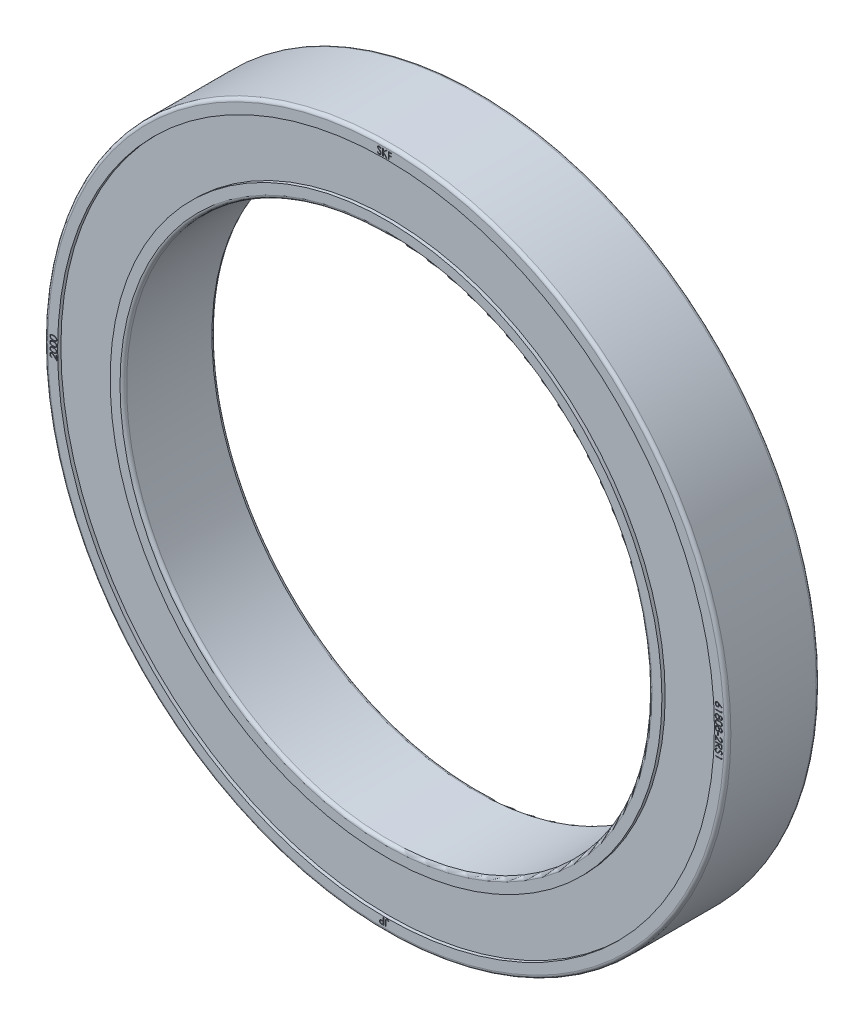
from build123d import *

# Parameters (mm, degrees)
SKETCH1_R           = 26
SKETCH1_R_2         = 20
BOSS_EXTRUDE1_DEPTH = 7
SKETCH2_R           = 25
SKETCH2_R_2         = 21
CUT_EXTRUDE1_DEPTH  = 0.25
CUT_EXTRUDE2_START  = -0.25
SKETCH3_R           = 25
SKETCH3_R_2         = 21
CUT_EXTRUDE2_DEPTH  = 0.25
FILLET1_R           = 0.25
CUT_EXTRUDE3_DEPTH  = 0.1
SKETCH5_W           = 0.053743489
SKETCH5_H           = 0.201538086
CUT_EXTRUDE4_DEPTH  = 0.1
CUT_EXTRUDE5_DEPTH  = 0.1
CUT_EXTRUDE6_DEPTH  = 0.1


with BuildPart() as part:
    # Sketch1 → Boss-Extrude1 (new body)
    with BuildSketch(Plane.XY):
        Circle(SKETCH1_R)
        Circle(SKETCH1_R_2, mode=Mode.SUBTRACT)
    extrude(amount=BOSS_EXTRUDE1_DEPTH)

    # Sketch2 → Cut-Extrude1 (cut)
    with BuildSketch(Plane.XY.offset(7)):
        Circle(SKETCH2_R)
        Circle(SKETCH2_R_2, mode=Mode.SUBTRACT)
    extrude(amount=-CUT_EXTRUDE1_DEPTH, mode=Mode.SUBTRACT)

    # Sketch3 → Cut-Extrude2 (cut)
    with BuildSketch(Plane(origin=(0, 0, 0), x_dir=(-1, 0, 0), z_dir=(0, 0, -1)).offset(CUT_EXTRUDE2_START)):
        Circle(SKETCH3_R)
        Circle(SKETCH3_R_2, mode=Mode.SUBTRACT)
    extrude(amount=CUT_EXTRUDE2_DEPTH, mode=Mode.SUBTRACT)

    # Fillet1
    fillet1_edges = [part.edges().sort_by_distance(p)[0] for p in [
        (-26, 0, 0),
        (-26, 0, 7),
        (-20, 0, 0),
        (-20, 0, 7),
    ]]
    fillet(fillet1_edges, radius=FILLET1_R)

    # Sketch4 → Cut-Extrude3 (cut)
    with BuildSketch(Plane.XY.offset(7)):
        with BuildLine():
            Line((-0.672721354, 25.186610114), (-0.628424962, 25.213166956))
            add(Edge.make_bspline(
                [(-0.628424962, 25.213166956), (-0.624305097, 25.206270472), (-0.616411593, 25.193057076), (-0.603244043, 25.175202477), (-0.58960017, 25.160027142), (-0.575378936, 25.147619353), (-0.560667147, 25.137850681), (-0.545368763, 25.130933559), (-0.529535338, 25.126619404), (-0.518759848, 25.126095392), (-0.513380305, 25.125833785)],
                knots=[0, 0, 0, 0, 1.272034388, 2.437168799, 3.508375237, 4.49857839, 5.41946034, 6.295179144, 7.148887113, 8, 8, 8, 8], degree=3))
            add(Edge.make_bspline(
                [(-0.513380305, 25.125833785), (-0.508786052, 25.125961742), (-0.499677935, 25.126215416), (-0.486269213, 25.12865288), (-0.473246819, 25.132397546), (-0.460879149, 25.137760441), (-0.449336855, 25.144248819), (-0.439215186, 25.152085775), (-0.430464984, 25.160859945), (-0.42330729, 25.170648644), (-0.417815775, 25.181176106), (-0.413595028, 25.191981857), (-0.411252741, 25.203235645), (-0.410899902, 25.21081274), (-0.410721842, 25.214636504)],
                knots=[0, 0, 0, 0, 1.095163259, 2.171163733, 3.241058638, 4.321873601, 5.38011039, 6.391990106, 7.366004449, 8.327778327, 9.272591725, 10.192022065, 11.087607919, 12, 12, 12, 12], degree=3))
            add(Edge.make_bspline(
                [(-0.410721842, 25.214636504), (-0.410942567, 25.218999298), (-0.411391269, 25.227868219), (-0.415183746, 25.240953171), (-0.421149737, 25.25390232), (-0.426653619, 25.261912209), (-0.42951107, 25.266070703)],
                knots=[0, 0, 0, 0, 0.938893495, 1.908633276, 2.914225137, 4, 4, 4, 4], degree=3))
            add(Edge.make_bspline(
                [(-0.42951107, 25.266070703), (-0.431857181, 25.269071994), (-0.436782546, 25.275372827), (-0.445249998, 25.284751696), (-0.455185935, 25.294425979), (-0.466250332, 25.304765087), (-0.478846234, 25.315288154), (-0.492579128, 25.326496984), (-0.507799631, 25.337965313), (-0.518474165, 25.345656506), (-0.523982048, 25.349625035)],
                knots=[0, 0, 0, 0, 0.722233717, 1.516239348, 2.393582979, 3.351407094, 4.387010283, 5.505090956, 6.712668013, 8, 8, 8, 8], degree=3))
            add(Edge.make_bspline(
                [(-0.523982048, 25.349625035), (-0.529495116, 25.353551822), (-0.540035682, 25.361059539), (-0.554776311, 25.372201897), (-0.5679578, 25.382389017), (-0.579521563, 25.391716801), (-0.589462513, 25.400186512), (-0.597858985, 25.407716818), (-0.604497088, 25.414511373), (-0.608188374, 25.418919154), (-0.60984567, 25.420898139)],
                knots=[0, 0, 0, 0, 1.452282411, 2.77665338, 3.964542531, 5.026858415, 5.96415736, 6.766646006, 7.446254459, 8, 8, 8, 8], degree=3))
            add(Edge.make_bspline(
                [(-0.60984567, 25.420898139), (-0.612162127, 25.423982403), (-0.61671775, 25.430048021), (-0.622731163, 25.43952864), (-0.627842274, 25.44923359), (-0.63184897, 25.459188953), (-0.635222958, 25.469254963), (-0.637492312, 25.479562959), (-0.638913308, 25.490066687), (-0.639058828, 25.497135209), (-0.639131673, 25.500673631)],
                knots=[0, 0, 0, 0, 1.068054152, 2.10047183, 3.106115577, 4.101338837, 5.06977816, 6.043150881, 7.020423561, 8, 8, 8, 8], degree=3))
            add(Edge.make_bspline(
                [(-0.639131673, 25.500673631), (-0.638936265, 25.506217507), (-0.638549626, 25.517186763), (-0.635279794, 25.533210777), (-0.630118719, 25.548509515), (-0.622888298, 25.562931515), (-0.6135675, 25.576101255), (-0.602781209, 25.588170223), (-0.589934027, 25.598316129), (-0.575838061, 25.607181003), (-0.560409079, 25.614119638), (-0.544241328, 25.619353786), (-0.527309112, 25.622319509), (-0.51584055, 25.622745111), (-0.510021337, 25.622961064)],
                knots=[0, 0, 0, 0, 1.005424448, 1.989358655, 2.955360095, 3.929531133, 4.905563448, 5.876582895, 6.856512386, 7.866279853, 8.892233794, 9.918561126, 10.94386622, 12, 12, 12, 12], degree=3))
            add(Edge.make_bspline(
                [(-0.510021337, 25.622961064), (-0.503846517, 25.622748088), (-0.491566772, 25.622324547), (-0.473503895, 25.618641952), (-0.456113008, 25.612548491), (-0.442123243, 25.605633402), (-0.431174244, 25.598726883), (-0.422824285, 25.592435927), (-0.414362831, 25.585193495), (-0.40572163, 25.576980298), (-0.397047101, 25.567720973), (-0.388210464, 25.557478935), (-0.379191053, 25.546316774), (-0.373388758, 25.538348321), (-0.370414225, 25.534263312)],
                knots=[0, 0, 0, 0, 1.286793592, 2.559021753, 3.825965368, 5.121522368, 5.803751409, 6.523245864, 7.299691795, 8.125521123, 9.008227632, 9.944561021, 10.946284179, 12, 12, 12, 12], degree=3))
            Line((-0.370414225, 25.534263312), (-0.412926165, 25.502038212))
            add(Edge.make_bspline(
                [(-0.412926165, 25.502038212), (-0.415493152, 25.505345199), (-0.420436567, 25.511713681), (-0.427941653, 25.520632341), (-0.435015438, 25.528779251), (-0.441984684, 25.535855502), (-0.448481319, 25.54224861), (-0.45478683, 25.547722117), (-0.460810476, 25.552329655), (-0.468403508, 25.557246796), (-0.477942943, 25.562120961), (-0.489917748, 25.566245444), (-0.502431784, 25.568723968), (-0.510954948, 25.569051675), (-0.515269725, 25.569217574)],
                knots=[0, 0, 0, 0, 1.181633172, 2.275549214, 3.290209073, 4.226197932, 5.078386478, 5.862611352, 6.581680152, 7.217281963, 8.414376989, 9.595101626, 10.782541182, 12, 12, 12, 12], degree=3))
            add(Edge.make_bspline(
                [(-0.515269725, 25.569217574), (-0.520682862, 25.569036166), (-0.531121589, 25.568686337), (-0.545941814, 25.564865637), (-0.559280422, 25.55884985), (-0.570741413, 25.550418709), (-0.580283732, 25.540429642), (-0.587186365, 25.528934772), (-0.591340953, 25.516241659), (-0.591847926, 25.507387324), (-0.59210612, 25.502877954)],
                knots=[0, 0, 0, 0, 1.14458467, 2.207223713, 3.21896685, 4.227309161, 5.202851033, 6.127160689, 7.046193047, 8, 8, 8, 8], degree=3))
            add(Edge.make_bspline(
                [(-0.59210612, 25.502877954), (-0.592047263, 25.500070595), (-0.591929454, 25.494451287), (-0.590286373, 25.486149432), (-0.588175506, 25.47786855), (-0.584830501, 25.46964587), (-0.580212527, 25.461337587), (-0.574148335, 25.452800634), (-0.566510927, 25.443959766), (-0.560660551, 25.438209645), (-0.557571729, 25.435173754)],
                knots=[0, 0, 0, 0, 0.858281714, 1.717966888, 2.583508476, 3.4729293, 4.427298488, 5.488583878, 6.674047936, 8, 8, 8, 8], degree=3))
            add(Edge.make_bspline(
                [(-0.557571729, 25.435173754), (-0.556424714, 25.434150155), (-0.55369967, 25.431718319), (-0.548717798, 25.427737082), (-0.542138945, 25.422826048), (-0.534134905, 25.416749558), (-0.524558095, 25.409700804), (-0.513407462, 25.401769912), (-0.500807302, 25.39269942), (-0.491866094, 25.386357903), (-0.487138367, 25.38300478)],
                knots=[0, 0, 0, 0, 0.420754252, 0.999615792, 1.744751191, 2.668019286, 3.750313428, 4.999500688, 6.413464383, 8, 8, 8, 8], degree=3))
            add(Edge.make_bspline(
                [(-0.487138367, 25.38300478), (-0.481451343, 25.378866482), (-0.470439211, 25.37085324), (-0.454770505, 25.358813886), (-0.440563573, 25.347039213), (-0.427768535, 25.335604416), (-0.416258985, 25.32459623), (-0.406162613, 25.31388222), (-0.397376545, 25.303539142), (-0.387917731, 25.290278587), (-0.378252521, 25.273992535), (-0.369952151, 25.254038916), (-0.364718397, 25.234007733), (-0.364033977, 25.220544426), (-0.363696289, 25.21390173)],
                knots=[0, 0, 0, 0, 1.163667725, 2.253281268, 3.268753668, 4.215851969, 5.092017293, 5.902905408, 6.650798638, 7.335211899, 8.59617414, 9.77448103, 10.901945474, 12, 12, 12, 12], degree=3))
            add(Edge.make_bspline(
                [(-0.363696289, 25.21390173), (-0.363794672, 25.209203949), (-0.363989527, 25.199899615), (-0.366229385, 25.186237452), (-0.369511066, 25.17296817), (-0.374457203, 25.160255787), (-0.380494144, 25.147867737), (-0.388154448, 25.136128976), (-0.397033639, 25.124779696), (-0.407219247, 25.114122531), (-0.418364841, 25.10433929), (-0.430144893, 25.095636555), (-0.442578682, 25.088380168), (-0.455598757, 25.082458853), (-0.46920811, 25.077827672), (-0.483402164, 25.074472152), (-0.498204314, 25.072412729), (-0.508265168, 25.072198973), (-0.513380305, 25.072090296)],
                knots=[0, 0, 0, 0, 0.983748083, 1.948392443, 2.894712957, 3.844097841, 4.80183111, 5.778335162, 6.776009319, 7.81870978, 8.863265674, 9.881300176, 10.883814829, 11.87499822, 12.874611388, 13.892143829, 14.928324115, 16, 16, 16, 16], degree=3))
            add(Edge.make_bspline(
                [(-0.513380305, 25.072090296), (-0.517338046, 25.072166827), (-0.525203685, 25.072318925), (-0.536837883, 25.073663548), (-0.548237046, 25.07556598), (-0.559258135, 25.078586321), (-0.570043144, 25.082250867), (-0.580545168, 25.086762997), (-0.590769295, 25.092170248), (-0.600772823, 25.098352692), (-0.61053031, 25.105547609), (-0.619950235, 25.113927626), (-0.629341673, 25.123261621), (-0.638427426, 25.133803069), (-0.647391275, 25.145381663), (-0.656056483, 25.158105734), (-0.664602416, 25.171905975), (-0.669964493, 25.181617187), (-0.672721354, 25.186610114)],
                knots=[0, 0, 0, 0, 0.915332311, 1.819136955, 2.706846663, 3.586547465, 4.459518054, 5.340707479, 6.227863349, 7.133153174, 8.059268498, 9.028702269, 10.047606654, 11.120612155, 12.245963614, 13.433783089, 14.680604001, 16, 16, 16, 16], degree=3))
        make_face()
        Polygon((-0.25620931, 25.609525191), (-0.209183757, 25.609525191), (-0.209183757, 25.409981493), (0.009254138, 25.609525191), (0.076328532, 25.609525191), (-0.181157366, 25.374397424), (0.09648234, 25.085526168), (0.033816592, 25.085526168), (-0.209183757, 25.338393485), (-0.209183757, 25.085526168), (-0.25620931, 25.085526168), align=None)
        Polygon((0.173738607, 25.609525191), (0.429020182, 25.609525191), (0.429020182, 25.555781702), (0.22076416, 25.555781702), (0.22076416, 25.394551233), (0.429020182, 25.394551233), (0.429020182, 25.340807743), (0.22076416, 25.340807743), (0.22076416, 25.085526168), (0.173738607, 25.085526168), align=None)
    extrude(amount=-CUT_EXTRUDE3_DEPTH, mode=Mode.SUBTRACT)

    # Sketch5 → Cut-Extrude4 (cut)
    # profile 1 of 10: a face of its own
    with BuildSketch(Plane.XY.offset(7)):
        with BuildLine():
            Line((25.606403456, 1.63338623), (25.577957195, 1.597172356))
            Line((25.577957195, 1.597172356), (25.366237237, 1.735624822))
            add(Edge.make_bspline(
                [(25.366237237, 1.735624822), (25.36770651, 1.726406889), (25.370572492, 1.708426269), (25.37104528, 1.690226151), (25.37127569, 1.681356494)],
                knots=[0, 0, 0, 0, 1.025318673, 2, 2, 2, 2], degree=3))
            add(Edge.make_bspline(
                [(25.37127569, 1.681356494), (25.371132546, 1.676030793), (25.370850773, 1.665547309), (25.368682338, 1.650155691), (25.365265099, 1.635365603), (25.360283776, 1.621238348), (25.353920578, 1.607723218), (25.346294316, 1.594742655), (25.337011197, 1.582540663), (25.326641263, 1.570960108), (25.315155656, 1.560446128), (25.302968735, 1.551137501), (25.290093199, 1.543318419), (25.276535568, 1.536974449), (25.26231674, 1.532048128), (25.24745491, 1.528456842), (25.231939827, 1.526333958), (25.221388257, 1.526045685), (25.216028383, 1.525899251)],
                knots=[0, 0, 0, 0, 1.04369286, 2.054478336, 3.041073146, 4.015093852, 4.984733326, 5.965804835, 6.960378782, 7.985147595, 9.009457201, 10.008161701, 10.986880575, 11.956520048, 12.937015923, 13.931873656, 14.949455224, 16, 16, 16, 16], degree=3))
            add(Edge.make_bspline(
                [(25.216028383, 1.525899251), (25.208699794, 1.526172708), (25.194287369, 1.526710489), (25.173208024, 1.530625308), (25.153287364, 1.537381411), (25.134447105, 1.546420267), (25.117235405, 1.558147471), (25.101680644, 1.572044853), (25.088122384, 1.588243782), (25.076491318, 1.606360663), (25.06725045, 1.625968754), (25.060418489, 1.64652848), (25.056336218, 1.667864106), (25.055801763, 1.682353931), (25.055532688, 1.689648946)],
                knots=[0, 0, 0, 0, 1.031881447, 2.029301251, 3.006342947, 3.987068354, 4.962916383, 5.929513747, 6.915671209, 7.928552063, 8.953527267, 9.960179832, 10.973036711, 12, 12, 12, 12], degree=3))
            add(Edge.make_bspline(
                [(25.055532688, 1.689648946), (25.055761481, 1.696699983), (25.056214681, 1.710666853), (25.060251868, 1.731212505), (25.066795401, 1.750954321), (25.075810443, 1.769753532), (25.087196925, 1.787169412), (25.100906732, 1.802745609), (25.116636861, 1.816427931), (25.134435565, 1.827754473), (25.153438265, 1.836985635), (25.173433232, 1.843496507), (25.194018061, 1.847707105), (25.208030395, 1.848141521), (25.215083673, 1.848360189)],
                knots=[0, 0, 0, 0, 1.011913813, 2.004424092, 2.994488568, 3.992479987, 4.990471406, 5.973328987, 6.963763268, 7.974390938, 8.994854117, 9.989689954, 10.988086187, 12, 12, 12, 12], degree=3))
            add(Edge.make_bspline(
                [(25.215083673, 1.848360189), (25.220478087, 1.848170284), (25.231487549, 1.847782708), (25.24820992, 1.845469699), (25.265253447, 1.841227356), (25.279701695, 1.836636215), (25.291667462, 1.832080417), (25.301116513, 1.827856176), (25.311095013, 1.82313296), (25.321414161, 1.817596693), (25.332368796, 1.811727803), (25.343553235, 1.804872274), (25.355375968, 1.797718423), (25.36324736, 1.792477695), (25.367286915, 1.789788183)],
                knots=[0, 0, 0, 0, 1.17367173, 2.395347028, 3.66355231, 4.98980831, 5.690886799, 6.447442954, 7.240630024, 8.091733897, 8.994365608, 9.943299771, 10.944512865, 12, 12, 12, 12], degree=3))
            Line((25.367286915, 1.789788183), (25.606403456, 1.63338623))
        make_face()
        with BuildLine():
            add(Edge.make_bspline(
                [(25.3175322, 1.691223462), (25.317414173, 1.695215049), (25.317182605, 1.703046508), (25.315874706, 1.714521897), (25.313396596, 1.725353283), (25.310191104, 1.735664378), (25.305826603, 1.745347714), (25.300587964, 1.754513749), (25.294359564, 1.763071529), (25.287210849, 1.770870765), (25.279498368, 1.77803239), (25.27118812, 1.784192557), (25.262533996, 1.789512111), (25.25345466, 1.793835767), (25.243955934, 1.797202943), (25.234080883, 1.799638502), (25.223763453, 1.800993982), (25.216766942, 1.801219485), (25.213194253, 1.801334635)],
                knots=[0, 0, 0, 0, 1.129474985, 2.216020618, 3.260639938, 4.268601163, 5.26556745, 6.258792394, 7.250684778, 8.252748164, 9.247500881, 10.223461414, 11.174097059, 12.117127289, 13.062595836, 14.020469732, 14.98917545, 16, 16, 16, 16], degree=3))
            add(Edge.make_bspline(
                [(25.213194253, 1.801334635), (25.209653655, 1.801240619), (25.202711068, 1.801056266), (25.192477813, 1.799390055), (25.182639099, 1.796826732), (25.17318773, 1.793074706), (25.164175263, 1.788368568), (25.155537679, 1.782577146), (25.147269016, 1.775798503), (25.13957778, 1.767918465), (25.132523192, 1.759420608), (25.126241773, 1.750433562), (25.120967062, 1.740985901), (25.116796986, 1.731023717), (25.113381595, 1.720686488), (25.110976492, 1.709895354), (25.109617138, 1.698640834), (25.109391323, 1.691017119), (25.109276178, 1.68712972)],
                knots=[0, 0, 0, 0, 0.989642335, 1.94054129, 2.892446913, 3.828371744, 4.778262963, 5.730973156, 6.732161388, 7.763274768, 8.805796303, 9.818398792, 10.825975928, 11.825728216, 12.834635236, 13.867465554, 14.912602056, 16, 16, 16, 16], degree=3))
            add(Edge.make_bspline(
                [(25.109276178, 1.68712972), (25.109391314, 1.683242315), (25.109617112, 1.675618587), (25.110976594, 1.664364158), (25.113381222, 1.65357269), (25.116798338, 1.643236676), (25.120962048, 1.633270002), (25.126274826, 1.623814071), (25.132485001, 1.614741223), (25.139589922, 1.606248941), (25.147225557, 1.598335967), (25.155612546, 1.591716094), (25.164106613, 1.585741708), (25.173223644, 1.58121632), (25.182633409, 1.577422508), (25.192479337, 1.574872117), (25.202710669, 1.573202459), (25.20965352, 1.57301858), (25.213194253, 1.572924805)],
                knots=[0, 0, 0, 0, 1.087205562, 2.132157158, 3.164804748, 4.173533273, 5.173108684, 6.180507559, 7.20098426, 8.243321352, 9.274252308, 10.269075238, 11.227079059, 12.172305571, 13.108064818, 14.05980203, 15.010532752, 16, 16, 16, 16], degree=3))
            add(Edge.make_bspline(
                [(25.213194253, 1.572924805), (25.216772018, 1.573006231), (25.223794005, 1.573166044), (25.234071587, 1.575008626), (25.244036235, 1.577497339), (25.253463479, 1.581519327), (25.262614021, 1.586309843), (25.271226331, 1.592412646), (25.279544397, 1.599409659), (25.287262, 1.607512879), (25.294321147, 1.616328457), (25.300552027, 1.625703181), (25.305810767, 1.635510565), (25.310198441, 1.645741134), (25.313364816, 1.656511986), (25.315858039, 1.667649263), (25.317184807, 1.679295402), (25.317414927, 1.687196799), (25.3175322, 1.691223462)],
                knots=[0, 0, 0, 0, 0.978265087, 1.920016216, 2.851775529, 3.783928695, 4.718195979, 5.674835085, 6.667117013, 7.690134047, 8.732874136, 9.755756613, 10.767227014, 11.776017537, 12.797239016, 13.836276431, 14.897336092, 16, 16, 16, 16], degree=3))
        make_face(mode=Mode.SUBTRACT)
    # profile 2 of 10: a face of its own
    with BuildSketch(Plane.XY.offset(7)):
        Polygon((25.592967584, 1.360784976), (25.592967584, 1.26389974), (25.068968561, 1.26389974), (25.068968561, 1.310925293), (25.539224094, 1.310925293), (25.539224094, 1.391540527), align=None)
    # profile 3 of 10: a face of its own
    with BuildSketch(Plane.XY.offset(7)):
        with BuildLine():
            add(Edge.make_bspline(
                [(25.360883882, 0.814322853), (25.358644727, 0.810070025), (25.354263966, 0.801749645), (25.347232867, 0.789844759), (25.339887962, 0.77888413), (25.332459815, 0.768711553), (25.324654812, 0.759534516), (25.316562043, 0.751292293), (25.308398286, 0.743726305), (25.299844109, 0.737234324), (25.291075942, 0.731509591), (25.282018415, 0.726568821), (25.272700097, 0.722343884), (25.263016968, 0.718995952), (25.253111878, 0.716237921), (25.242856763, 0.714340214), (25.232319244, 0.713319623), (25.225197602, 0.71312667), (25.221591674, 0.713028971)],
                knots=[0, 0, 0, 0, 1.264385854, 2.473688339, 3.635349404, 4.734491366, 5.785876313, 6.801388178, 7.772322209, 8.711311751, 9.622826105, 10.524996139, 11.423212571, 12.31118177, 13.217849097, 14.126010572, 15.051135535, 16, 16, 16, 16], degree=3))
            add(Edge.make_bspline(
                [(25.221591674, 0.713028971), (25.216546305, 0.713143436), (25.206559626, 0.713370006), (25.191825901, 0.715376136), (25.177482407, 0.718304041), (25.163667814, 0.722863423), (25.150209008, 0.72830932), (25.137352073, 0.735315148), (25.124737496, 0.743177213), (25.116980195, 0.749504957), (25.113055017, 0.752706782)],
                knots=[0, 0, 0, 0, 1.02534174, 2.029536028, 3.018826961, 3.997522084, 4.983122576, 5.966563916, 6.971085759, 8, 8, 8, 8], degree=3))
            add(Edge.make_bspline(
                [(25.113055017, 0.752706782), (25.1084747, 0.756874292), (25.099370668, 0.765157813), (25.087550626, 0.779348145), (25.077617192, 0.794921678), (25.069521872, 0.811818151), (25.063221029, 0.829992399), (25.058693301, 0.849440548), (25.056099891, 0.870200514), (25.055725008, 0.884469078), (25.055532688, 0.891789055)],
                knots=[0, 0, 0, 0, 0.954267603, 1.896743057, 2.838368354, 3.796610408, 4.779680527, 5.799409237, 6.871065594, 8, 8, 8, 8], degree=3))
            add(Edge.make_bspline(
                [(25.055532688, 0.891789055), (25.055705693, 0.898827456), (25.056042344, 0.912523468), (25.058310788, 0.932461299), (25.062326802, 0.951069054), (25.067709877, 0.96843495), (25.074888329, 0.984391083), (25.083687037, 0.998966404), (25.093907261, 1.012374754), (25.105795312, 1.024194719), (25.118530022, 1.03468779), (25.131667577, 1.043905428), (25.145209734, 1.051566895), (25.158954427, 1.05805357), (25.173094341, 1.063019287), (25.187556716, 1.066458549), (25.202316293, 1.068642774), (25.212277013, 1.068933389), (25.217287996, 1.06907959)],
                knots=[0, 0, 0, 0, 1.256882982, 2.445766618, 3.576898315, 4.651879663, 5.686612882, 6.692806257, 7.686348993, 8.689277895, 9.678883454, 10.630458183, 11.551151498, 12.454054546, 13.341321255, 14.221808008, 15.105437234, 16, 16, 16, 16], degree=3))
            add(Edge.make_bspline(
                [(25.217287996, 1.06907959), (25.220964854, 1.068993077), (25.228231622, 1.068822097), (25.238967473, 1.067638571), (25.249417081, 1.06573616), (25.259618153, 1.06315135), (25.269499717, 1.059652452), (25.279096301, 1.055412756), (25.288481638, 1.050517079), (25.297494383, 1.044649073), (25.306434902, 1.038188684), (25.314866503, 1.030525194), (25.323258893, 1.022120143), (25.331248935, 1.012630361), (25.339220661, 1.002346308), (25.346666764, 0.990956282), (25.354132053, 0.97878029), (25.358594657, 0.970125887), (25.360883882, 0.965686353)],
                knots=[0, 0, 0, 0, 0.941717298, 1.86116577, 2.762973304, 3.660719123, 4.553575492, 5.444450535, 6.34648071, 7.261375261, 8.197060099, 9.168336537, 10.175980388, 11.237504102, 12.343496232, 13.506792996, 14.721035322, 16, 16, 16, 16], degree=3))
            add(Edge.make_bspline(
                [(25.360883882, 0.965686353), (25.364197251, 0.97176408), (25.37061286, 0.98353226), (25.382409353, 0.999104386), (25.395138949, 1.01250167), (25.409222365, 1.023204909), (25.424039315, 1.031698017), (25.439542318, 1.037695557), (25.455545741, 1.041612024), (25.466458921, 1.04200865), (25.471939765, 1.042207845)],
                knots=[0, 0, 0, 0, 1.16709546, 2.25982348, 3.287408737, 4.277418348, 5.234967981, 6.16072867, 7.076276605, 8, 8, 8, 8], degree=3))
            add(Edge.make_bspline(
                [(25.471939765, 1.042207845), (25.477523726, 1.041962994), (25.488748461, 1.041470802), (25.505457552, 1.03749098), (25.521868322, 1.031005066), (25.537903498, 1.022184927), (25.553011573, 1.01119336), (25.566607541, 0.998009085), (25.578414255, 0.982857694), (25.588388953, 0.9660082), (25.59654764, 0.947911002), (25.602117076, 0.928783885), (25.605780197, 0.908968655), (25.606193763, 0.895479507), (25.606403456, 0.888640022)],
                knots=[0, 0, 0, 0, 0.888753872, 1.786550278, 2.720173491, 3.693036334, 4.694165094, 5.687489879, 6.699912706, 7.744713188, 8.800178723, 9.852977058, 10.911381959, 12, 12, 12, 12], degree=3))
            add(Edge.make_bspline(
                [(25.606403456, 0.888640022), (25.606187846, 0.881976938), (25.605762687, 0.868838094), (25.602181975, 0.849496355), (25.596268012, 0.830974673), (25.588215419, 0.813374116), (25.578173593, 0.79707925), (25.566247771, 0.782530457), (25.552699575, 0.769768454), (25.537632416, 0.759165155), (25.521597629, 0.750608201), (25.504921156, 0.744514342), (25.487826466, 0.74063815), (25.476263516, 0.740146863), (25.470470216, 0.739900716)],
                knots=[0, 0, 0, 0, 1.072712831, 2.115267497, 3.156282165, 4.197922255, 5.225560591, 6.230883479, 7.219814004, 8.214446311, 9.19021444, 10.138875805, 11.067534608, 12, 12, 12, 12], degree=3))
            add(Edge.make_bspline(
                [(25.470470216, 0.739900716), (25.464784544, 0.740115459), (25.453618207, 0.740537202), (25.437340805, 0.744085855), (25.422094825, 0.750059795), (25.407718165, 0.758224564), (25.394409734, 0.768849514), (25.38221378, 0.781916443), (25.370645483, 0.79701983), (25.364210483, 0.808426253), (25.360883882, 0.814322853)],
                knots=[0, 0, 0, 0, 0.975287281, 1.915408787, 2.843441052, 3.776938647, 4.743139116, 5.754296123, 6.83907365, 8, 8, 8, 8], degree=3))
        make_face()
        with BuildLine():
            add(Edge.make_bspline(
                [(25.552659967, 0.891264216), (25.552562437, 0.894939816), (25.552371626, 0.902130895), (25.551374735, 0.912675054), (25.549435457, 0.922701755), (25.54685458, 0.93231576), (25.543368042, 0.941385257), (25.539266626, 0.95003342), (25.534280241, 0.958113064), (25.528686747, 0.965721725), (25.522534563, 0.972571257), (25.51612475, 0.978650327), (25.509331418, 0.983699898), (25.502323551, 0.987987873), (25.494893158, 0.991099157), (25.487268048, 0.993429352), (25.479351862, 0.995004551), (25.473941721, 0.995122584), (25.47120499, 0.995182292)],
                knots=[0, 0, 0, 0, 1.203892937, 2.355340988, 3.463153438, 4.544400666, 5.610487187, 6.640501085, 7.674077295, 8.714426146, 9.728707835, 10.68524104, 11.601827946, 12.495867327, 13.368432065, 14.231010473, 15.105153427, 16, 16, 16, 16], degree=3))
            add(Edge.make_bspline(
                [(25.47120499, 0.995182292), (25.468469375, 0.995075829), (25.463063407, 0.994865445), (25.455048303, 0.993342672), (25.447274426, 0.990796584), (25.439669202, 0.98730535), (25.432252154, 0.982825005), (25.424994859, 0.977387204), (25.418089231, 0.970756002), (25.411339344, 0.963433154), (25.405120573, 0.955434238), (25.399565627, 0.947028832), (25.395137273, 0.938155594), (25.391254511, 0.929080256), (25.38834199, 0.919610896), (25.386243689, 0.909812806), (25.38494576, 0.899696452), (25.384790246, 0.892842574), (25.384711562, 0.889374797)],
                knots=[0, 0, 0, 0, 0.873213166, 1.72559466, 2.594724523, 3.479581045, 4.391597569, 5.35687048, 6.368548091, 7.443976143, 8.534559525, 9.600545123, 10.654815915, 11.696401765, 12.749428718, 13.812189468, 14.893058657, 16, 16, 16, 16], degree=3))
            add(Edge.make_bspline(
                [(25.384711562, 0.889374797), (25.384842242, 0.884920789), (25.385102313, 0.876056767), (25.387520369, 0.862989828), (25.391323991, 0.850284702), (25.396528045, 0.838077186), (25.403059747, 0.826683263), (25.410879761, 0.816526655), (25.419807521, 0.807693994), (25.429704042, 0.80027707), (25.44023666, 0.794526578), (25.450806513, 0.790049859), (25.461526369, 0.787435671), (25.468707696, 0.787094687), (25.472254668, 0.78692627)],
                knots=[0, 0, 0, 0, 1.076279235, 2.141928126, 3.20205304, 4.278698113, 5.344010996, 6.36967002, 7.368914609, 8.37248503, 9.349703398, 10.264243087, 11.142681841, 12, 12, 12, 12], degree=3))
            add(Edge.make_bspline(
                [(25.472254668, 0.78692627), (25.474744238, 0.787005696), (25.479685677, 0.787163347), (25.486980728, 0.788468895), (25.494118307, 0.790609561), (25.501100144, 0.793562217), (25.508024418, 0.797220034), (25.514598809, 0.80194526), (25.521189197, 0.807309189), (25.527503519, 0.813540306), (25.533449222, 0.820564862), (25.538564055, 0.828493756), (25.543006205, 0.8371253), (25.546575533, 0.846529914), (25.549263795, 0.8566709), (25.551274816, 0.867509525), (25.552408785, 0.879133873), (25.552574424, 0.887133071), (25.552659967, 0.891264216)],
                knots=[0, 0, 0, 0, 0.814272661, 1.61621452, 2.416847352, 3.248328223, 4.093649164, 4.973549185, 5.892801723, 6.872536627, 7.872406081, 8.898230315, 9.953166191, 11.044090313, 12.18293744, 13.382234284, 14.648068262, 16, 16, 16, 16], degree=3))
        make_face(mode=Mode.SUBTRACT)
        with BuildLine():
            add(Edge.make_bspline(
                [(25.330968072, 0.888220151), (25.330885216, 0.892880134), (25.330722671, 0.902021883), (25.328912262, 0.915414602), (25.326394274, 0.928268883), (25.322566131, 0.940536324), (25.317629609, 0.952201886), (25.311589901, 0.963291847), (25.30455725, 0.9738219), (25.296493233, 0.983619509), (25.287759698, 0.992546152), (25.278632208, 1.000515402), (25.269045203, 1.007148907), (25.259084202, 1.012569343), (25.248761614, 1.016768182), (25.238079512, 1.019868557), (25.227005969, 1.021668279), (25.21949863, 1.021924734), (25.215713479, 1.022054036)],
                knots=[0, 0, 0, 0, 1.140506561, 2.237395584, 3.304560074, 4.345354409, 5.3782877, 6.402081073, 7.433555996, 8.474808822, 9.504965884, 10.489266388, 11.437701257, 12.354123303, 13.261162422, 14.161620169, 15.073101032, 16, 16, 16, 16], degree=3))
            add(Edge.make_bspline(
                [(25.215713479, 1.022054036), (25.211007531, 1.021850501), (25.20167104, 1.02144669), (25.187877408, 1.018225974), (25.174486151, 1.013097186), (25.161732891, 1.005767377), (25.149776498, 0.996881101), (25.139234849, 0.986025354), (25.13007037, 0.973624471), (25.122555974, 0.959554751), (25.116528264, 0.944207077), (25.112426888, 0.927541673), (25.109691278, 0.909793824), (25.109416725, 0.897538088), (25.109276178, 0.891264216)],
                knots=[0, 0, 0, 0, 0.898956152, 1.783507998, 2.694187257, 3.631865312, 4.587204618, 5.533364321, 6.51415483, 7.525942309, 8.574485006, 9.65837228, 10.801290154, 12, 12, 12, 12], degree=3))
            add(Edge.make_bspline(
                [(25.109276178, 0.891264216), (25.109370213, 0.886360985), (25.109553423, 0.876807919), (25.111173951, 0.862872233), (25.113736231, 0.849718591), (25.117498614, 0.837353447), (25.122006176, 0.82562862), (25.127901113, 0.814806301), (25.134567799, 0.804598234), (25.142480578, 0.79548362), (25.150942853, 0.787194567), (25.159855162, 0.779934421), (25.16912674, 0.773790003), (25.178752545, 0.768837037), (25.188697105, 0.764903902), (25.199001267, 0.762068561), (25.209705499, 0.76032106), (25.216966436, 0.760144183), (25.220646964, 0.760054525)],
                knots=[0, 0, 0, 0, 1.22469164, 2.386092043, 3.500511288, 4.568136916, 5.611981868, 6.63276519, 7.641422348, 8.65223666, 9.641383647, 10.598487484, 11.519869765, 12.415254456, 13.298392158, 14.187051141, 15.081026348, 16, 16, 16, 16], degree=3))
            add(Edge.make_bspline(
                [(25.220646964, 0.760054525), (25.224222137, 0.760189254), (25.231271754, 0.760454917), (25.241710967, 0.762165068), (25.251837455, 0.765101415), (25.261607641, 0.769380983), (25.271127122, 0.774644291), (25.280325563, 0.78110044), (25.289130017, 0.788825062), (25.297549667, 0.79757445), (25.305337765, 0.807103931), (25.312226609, 0.817234955), (25.318028387, 0.827887694), (25.322746836, 0.839040093), (25.32645787, 0.85066726), (25.329050317, 0.862760677), (25.33068214, 0.875334493), (25.330871685, 0.883876406), (25.330968072, 0.888220151)],
                knots=[0, 0, 0, 0, 0.917481483, 1.809113215, 2.707052678, 3.61610275, 4.54058801, 5.494688304, 6.493986409, 7.541809048, 8.607637092, 9.648666143, 10.681335566, 11.715370464, 12.751897579, 13.808646822, 14.885650252, 16, 16, 16, 16], degree=3))
        make_face(mode=Mode.SUBTRACT)
    # profile 4 of 10: a face of its own
    with BuildSketch(Plane.XY.offset(7)):
        with BuildLine():
            add(Edge.make_bspline(
                [(25.330758137, 0.666003418), (25.339156702, 0.665954309), (25.355471034, 0.665858914), (25.379243319, 0.664797678), (25.401544761, 0.663034745), (25.422376427, 0.660618754), (25.441743696, 0.657678674), (25.459594805, 0.653753844), (25.476012398, 0.649290465), (25.491049935, 0.644117431), (25.504910267, 0.63828058), (25.517848789, 0.631926986), (25.529849076, 0.624807966), (25.541091403, 0.617318229), (25.551450301, 0.609184081), (25.560906152, 0.600491316), (25.569464666, 0.591153706), (25.577227704, 0.581355927), (25.583990299, 0.571036061), (25.590083848, 0.560512233), (25.595085195, 0.549598744), (25.599194698, 0.538395127), (25.602487538, 0.526933964), (25.604767824, 0.515167897), (25.60619695, 0.503094086), (25.606333968, 0.494945029), (25.606403456, 0.490812238)],
                knots=[0, 0, 0, 0, 1.646377244, 3.198111528, 4.663803227, 6.031090796, 7.308794487, 8.502186765, 9.612154809, 10.642545331, 11.617106989, 12.558866172, 13.465886467, 14.35053239, 15.20542558, 16.045215227, 16.865619885, 17.686225247, 18.492864914, 19.282407821, 20.068097601, 20.842842034, 21.620163247, 22.403093475, 23.190129512, 24, 24, 24, 24], degree=3))
            add(Edge.make_bspline(
                [(25.606403456, 0.490812238), (25.606330424, 0.486644877), (25.606185184, 0.478357307), (25.60478926, 0.466104657), (25.602473016, 0.454135069), (25.599191139, 0.442499576), (25.595119565, 0.431102599), (25.590016246, 0.420033283), (25.584075764, 0.409222871), (25.577095517, 0.398843156), (25.569313042, 0.388780187), (25.560515447, 0.379281138), (25.550791565, 0.370345145), (25.540245431, 0.361860058), (25.528674771, 0.354066606), (25.51628083, 0.346644769), (25.502846863, 0.340001654), (25.488597014, 0.333603674), (25.473136998, 0.328081176), (25.456553962, 0.323100753), (25.438652031, 0.319076595), (25.419525132, 0.315724607), (25.399103021, 0.313127833), (25.377429476, 0.31123655), (25.354490237, 0.310237496), (25.33880652, 0.31004935), (25.330758137, 0.309952799)],
                knots=[0, 0, 0, 0, 0.810914788, 1.612654377, 2.396697861, 3.181598691, 3.963628158, 4.749916497, 5.551656086, 6.361998678, 7.18212741, 8.025565596, 8.878627764, 9.750805457, 10.657531673, 11.591944965, 12.560506719, 13.57287815, 14.630710178, 15.753379473, 16.941251878, 18.199788006, 19.531962791, 20.947069417, 22.433333509, 24, 24, 24, 24], degree=3))
            add(Edge.make_bspline(
                [(25.330758137, 0.309952799), (25.322744888, 0.310050471), (25.3071314, 0.310240781), (25.284294962, 0.31122404), (25.262737893, 0.313169981), (25.242400184, 0.315576802), (25.223402588, 0.319005287), (25.20556446, 0.322902869), (25.189039741, 0.327747146), (25.173661259, 0.333194372), (25.159481225, 0.339453522), (25.146163388, 0.34615535), (25.13377956, 0.353531631), (25.122209069, 0.361371561), (25.111571473, 0.369784526), (25.101840482, 0.378758357), (25.093022514, 0.388299886), (25.085133706, 0.398385606), (25.078234714, 0.408928609), (25.072068124, 0.419702937), (25.067064319, 0.430923635), (25.06283951, 0.442341334), (25.059550083, 0.454063766), (25.057297834, 0.466079433), (25.055713868, 0.478348985), (25.055593291, 0.486643435), (25.055532688, 0.490812238)],
                knots=[0, 0, 0, 0, 1.56130642, 3.042141888, 4.451772327, 5.777565838, 7.030558081, 8.211376819, 9.333164717, 10.383253789, 11.387583522, 12.350962576, 13.286244149, 14.193812918, 15.072134482, 15.925989337, 16.770211267, 17.600669898, 18.417446232, 19.22325363, 20.01647746, 20.807971184, 21.593601364, 22.38506573, 23.188331689, 24, 24, 24, 24], degree=3))
            add(Edge.make_bspline(
                [(25.055532688, 0.490812238), (25.055602845, 0.494944861), (25.055741182, 0.503093587), (25.057160649, 0.515169824), (25.059475323, 0.52691754), (25.062618638, 0.538360219), (25.066613604, 0.54952128), (25.071695054, 0.560291388), (25.077588746, 0.57081278), (25.084293922, 0.581037446), (25.09197788, 0.59077051), (25.10047611, 0.600067738), (25.110001763, 0.608694377), (25.120402368, 0.616726578), (25.131589676, 0.624348702), (25.143673889, 0.631397961), (25.156733638, 0.637739162), (25.170670484, 0.643706821), (25.185818539, 0.648967301), (25.202323696, 0.653578937), (25.220277257, 0.65742338), (25.239625924, 0.660515101), (25.260384178, 0.663063915), (25.282588568, 0.664789331), (25.306219937, 0.665859759), (25.322429477, 0.665954658), (25.330758137, 0.666003418)],
                knots=[0, 0, 0, 0, 0.810940842, 1.599017053, 2.38298203, 3.159479784, 3.926441347, 4.70693857, 5.494146311, 6.292334103, 7.104379492, 7.925868426, 8.762126819, 9.623561095, 10.503686106, 11.41783325, 12.366995289, 13.351843594, 14.392337808, 15.512229747, 16.713911458, 17.994391108, 19.357476964, 20.818259213, 22.365182633, 24, 24, 24, 24], degree=3))
        make_face()
        with BuildLine():
            add(Edge.make_bspline(
                [(25.330968072, 0.618977865), (25.323969137, 0.618959982), (25.310385579, 0.618925274), (25.290646796, 0.618018576), (25.272236415, 0.616783401), (25.255131061, 0.61519025), (25.23938863, 0.612824328), (25.224900857, 0.610173369), (25.21174439, 0.606947334), (25.199829025, 0.603130322), (25.188952288, 0.598782935), (25.178831979, 0.594035522), (25.169345397, 0.588938281), (25.160588896, 0.583223735), (25.152475311, 0.577021499), (25.145027957, 0.570321391), (25.138279329, 0.563135194), (25.130271429, 0.553187141), (25.121898447, 0.540118535), (25.114697044, 0.523568125), (25.110142133, 0.506554418), (25.109564495, 0.495003262), (25.109276178, 0.489237722)],
                knots=[0, 0, 0, 0, 1.459116078, 2.831857795, 4.118796693, 5.306371758, 6.412361096, 7.436813035, 8.376339383, 9.234574298, 10.043323891, 10.816788787, 11.564361537, 12.286735248, 12.994408768, 13.691741332, 14.372975427, 15.047457468, 16.352811911, 17.594285292, 18.799233213, 20, 20, 20, 20], degree=3))
            add(Edge.make_bspline(
                [(25.109276178, 0.489237722), (25.109515388, 0.483435155), (25.109993314, 0.471842003), (25.114604317, 0.454904289), (25.121561458, 0.438461159), (25.129787869, 0.425574984), (25.137622153, 0.41577133), (25.144301591, 0.4087472), (25.151780684, 0.402300208), (25.159850163, 0.396185577), (25.168664199, 0.390577429), (25.178180406, 0.3854777), (25.188425213, 0.380824088), (25.195577012, 0.378172795), (25.199233542, 0.376817258)],
                knots=[0, 0, 0, 0, 1.353760809, 2.704726607, 4.075137775, 5.516104923, 6.260822281, 7.007110065, 7.778089737, 8.566572457, 9.372053459, 10.217411131, 11.088608312, 12, 12, 12, 12], degree=3))
            add(Edge.make_bspline(
                [(25.199233542, 0.376817258), (25.203909072, 0.375237511), (25.213402402, 0.372029946), (25.228128818, 0.367896077), (25.243579717, 0.364640486), (25.259662762, 0.361711576), (25.27649656, 0.359712436), (25.294029026, 0.358103338), (25.312273379, 0.357155546), (25.324668949, 0.357038057), (25.330968072, 0.356978353)],
                knots=[0, 0, 0, 0, 0.884706709, 1.796334032, 2.740027952, 3.714592787, 4.726048262, 5.777819803, 6.87074269, 8, 8, 8, 8], degree=3))
            add(Edge.make_bspline(
                [(25.330968072, 0.356978353), (25.337267061, 0.357044201), (25.349590753, 0.357173029), (25.367620325, 0.358019443), (25.384774457, 0.35937956), (25.401068711, 0.361220448), (25.416474085, 0.363747598), (25.431012624, 0.366782454), (25.444680407, 0.370340474), (25.457512684, 0.374421629), (25.469463332, 0.379021034), (25.480558369, 0.384101998), (25.490856615, 0.389524075), (25.50032851, 0.395414367), (25.509016807, 0.401701657), (25.516747226, 0.408552216), (25.523759377, 0.415694225), (25.531763472, 0.425697695), (25.539924637, 0.438793821), (25.547435154, 0.455089539), (25.551748158, 0.472047741), (25.55235625, 0.48351186), (25.552659967, 0.489237722)],
                knots=[0, 0, 0, 0, 1.313668642, 2.570134578, 3.763346207, 4.902004944, 5.98888779, 7.017888835, 7.998425394, 8.933058446, 9.82474457, 10.667209444, 11.476765193, 12.250262638, 12.991704352, 13.7104269, 14.401925311, 15.076585796, 16.378385137, 17.609787933, 18.806186071, 20, 20, 20, 20], degree=3))
            add(Edge.make_bspline(
                [(25.552659967, 0.489237722), (25.552356223, 0.495033483), (25.551748181, 0.506635564), (25.547446463, 0.523766339), (25.539994561, 0.540178139), (25.53171077, 0.553169196), (25.523901072, 0.563160045), (25.517109729, 0.570214979), (25.509639846, 0.576810607), (25.501560611, 0.58301801), (25.492799694, 0.588727055), (25.483314492, 0.593826382), (25.473193242, 0.59857107), (25.462318979, 0.602927791), (25.450385651, 0.606709429), (25.437295584, 0.610089515), (25.422794279, 0.612738866), (25.407007836, 0.615050801), (25.389881454, 0.616813521), (25.371428629, 0.618015406), (25.351655711, 0.618926915), (25.338002067, 0.618960541), (25.330968072, 0.618977865)],
                knots=[0, 0, 0, 0, 1.207964612, 2.418129846, 3.655795183, 4.951004962, 5.620895151, 6.296795572, 6.989224116, 7.696855977, 8.419187164, 9.166715907, 9.940135271, 10.748837255, 11.607021648, 12.548275234, 13.5654991, 14.678641405, 15.874140913, 17.15372626, 18.533675393, 20, 20, 20, 20], degree=3))
        make_face(mode=Mode.SUBTRACT)
    # profile 5 of 10: a face of its own
    with BuildSketch(Plane.XY.offset(7)):
        with BuildLine():
            add(Edge.make_bspline(
                [(25.360883882, 0.008170509), (25.358644727, 0.003917681), (25.354263966, -0.004402699), (25.347232867, -0.016307585), (25.339887962, -0.027268214), (25.332459815, -0.037440791), (25.324654812, -0.046617828), (25.316562043, -0.05486005), (25.308398286, -0.062426038), (25.299844109, -0.06891802), (25.291075942, -0.074642753), (25.282018415, -0.079583523), (25.272700097, -0.08380846), (25.263016968, -0.087156392), (25.253111878, -0.089914423), (25.242856763, -0.09181213), (25.232319244, -0.092832721), (25.225197602, -0.093025674), (25.221591674, -0.093123372)],
                knots=[0, 0, 0, 0, 1.264385854, 2.473688339, 3.635349404, 4.734491366, 5.785876313, 6.801388178, 7.772322209, 8.711311751, 9.622826105, 10.524996139, 11.423212571, 12.31118177, 13.217849097, 14.126010572, 15.051135535, 16, 16, 16, 16], degree=3))
            add(Edge.make_bspline(
                [(25.221591674, -0.093123372), (25.216546305, -0.093008907), (25.206559626, -0.092782338), (25.191825901, -0.090776208), (25.177482407, -0.087848303), (25.163667814, -0.083288921), (25.150209008, -0.077843024), (25.137352073, -0.070837196), (25.124737496, -0.062975131), (25.116980195, -0.056647387), (25.113055017, -0.053445562)],
                knots=[0, 0, 0, 0, 1.02534174, 2.029536028, 3.018826961, 3.997522084, 4.983122576, 5.966563916, 6.971085759, 8, 8, 8, 8], degree=3))
            add(Edge.make_bspline(
                [(25.113055017, -0.053445562), (25.1084747, -0.049278052), (25.099370668, -0.040994531), (25.087550626, -0.026804199), (25.077617192, -0.011230666), (25.069521872, 0.005665808), (25.063221029, 0.023840055), (25.058693301, 0.043288205), (25.056099891, 0.064048171), (25.055725008, 0.078316735), (25.055532688, 0.085636711)],
                knots=[0, 0, 0, 0, 0.954267603, 1.896743057, 2.838368354, 3.796610408, 4.779680527, 5.799409237, 6.871065594, 8, 8, 8, 8], degree=3))
            add(Edge.make_bspline(
                [(25.055532688, 0.085636711), (25.055705693, 0.092675112), (25.056042344, 0.106371125), (25.058310788, 0.126308955), (25.062326802, 0.14491671), (25.067709877, 0.162282606), (25.074888329, 0.178238739), (25.083687037, 0.192814061), (25.093907261, 0.20622241), (25.105795312, 0.218042375), (25.118530022, 0.228535446), (25.131667577, 0.237753085), (25.145209734, 0.245414551), (25.158954427, 0.251901227), (25.173094341, 0.256866944), (25.187556716, 0.260306205), (25.202316293, 0.26249043), (25.212277013, 0.262781045), (25.217287996, 0.262927246)],
                knots=[0, 0, 0, 0, 1.256882982, 2.445766618, 3.576898315, 4.651879663, 5.686612882, 6.692806257, 7.686348993, 8.689277895, 9.678883454, 10.630458183, 11.551151498, 12.454054546, 13.341321255, 14.221808008, 15.105437234, 16, 16, 16, 16], degree=3))
            add(Edge.make_bspline(
                [(25.217287996, 0.262927246), (25.220964854, 0.262840733), (25.228231622, 0.262669754), (25.238967473, 0.261486227), (25.249417081, 0.259583816), (25.259618153, 0.256999006), (25.269499717, 0.253500108), (25.279096301, 0.249260413), (25.288481638, 0.244364735), (25.297494383, 0.238496729), (25.306434902, 0.23203634), (25.314866503, 0.224372851), (25.323258893, 0.215967799), (25.331248935, 0.206478017), (25.339220661, 0.196193964), (25.346666764, 0.184803938), (25.354132053, 0.172627947), (25.358594657, 0.163973543), (25.360883882, 0.159534009)],
                knots=[0, 0, 0, 0, 0.941717298, 1.86116577, 2.762973304, 3.660719123, 4.553575492, 5.444450535, 6.34648071, 7.261375261, 8.197060099, 9.168336537, 10.175980388, 11.237504102, 12.343496232, 13.506792996, 14.721035322, 16, 16, 16, 16], degree=3))
            add(Edge.make_bspline(
                [(25.360883882, 0.159534009), (25.364197251, 0.165611736), (25.37061286, 0.177379916), (25.382409353, 0.192952043), (25.395138949, 0.206349326), (25.409222365, 0.217052565), (25.424039315, 0.225545673), (25.439542318, 0.231543213), (25.455545741, 0.23545968), (25.466458921, 0.235856307), (25.471939765, 0.236055501)],
                knots=[0, 0, 0, 0, 1.16709546, 2.25982348, 3.287408737, 4.277418348, 5.234967981, 6.16072867, 7.076276605, 8, 8, 8, 8], degree=3))
            add(Edge.make_bspline(
                [(25.471939765, 0.236055501), (25.477523726, 0.235810651), (25.488748461, 0.235318458), (25.505457552, 0.231338636), (25.521868322, 0.224852722), (25.537903498, 0.216032583), (25.553011573, 0.205041016), (25.566607541, 0.191856742), (25.578414255, 0.17670535), (25.588388953, 0.159855856), (25.59654764, 0.141758659), (25.602117076, 0.122631541), (25.605780197, 0.102816311), (25.606193763, 0.089327163), (25.606403456, 0.082487679)],
                knots=[0, 0, 0, 0, 0.888753872, 1.786550278, 2.720173491, 3.693036334, 4.694165094, 5.687489879, 6.699912706, 7.744713188, 8.800178723, 9.852977058, 10.911381959, 12, 12, 12, 12], degree=3))
            add(Edge.make_bspline(
                [(25.606403456, 0.082487679), (25.606187846, 0.075824594), (25.605762687, 0.06268575), (25.602181975, 0.043344011), (25.596268012, 0.024822329), (25.588215419, 0.007221772), (25.578173593, -0.009073094), (25.566247771, -0.023621886), (25.552699575, -0.03638389), (25.537632416, -0.046987188), (25.521597629, -0.055544143), (25.504921156, -0.061638002), (25.487826466, -0.065514193), (25.476263516, -0.066005481), (25.470470216, -0.066251628)],
                knots=[0, 0, 0, 0, 1.072712831, 2.115267497, 3.156282165, 4.197922255, 5.225560591, 6.230883479, 7.219814004, 8.214446311, 9.19021444, 10.138875805, 11.067534608, 12, 12, 12, 12], degree=3))
            add(Edge.make_bspline(
                [(25.470470216, -0.066251628), (25.464784544, -0.066036885), (25.453618207, -0.065615142), (25.437340805, -0.062066489), (25.422094825, -0.056092549), (25.407718165, -0.047927779), (25.394409734, -0.037302829), (25.38221378, -0.0242359), (25.370645483, -0.009132514), (25.364210483, 0.00227391), (25.360883882, 0.008170509)],
                knots=[0, 0, 0, 0, 0.975287281, 1.915408787, 2.843441052, 3.776938647, 4.743139116, 5.754296123, 6.83907365, 8, 8, 8, 8], degree=3))
        make_face()
        with BuildLine():
            add(Edge.make_bspline(
                [(25.552659967, 0.085111872), (25.552562437, 0.088787472), (25.552371626, 0.095978552), (25.551374735, 0.10652271), (25.549435457, 0.116549412), (25.54685458, 0.126163416), (25.543368042, 0.135232913), (25.539266626, 0.143881076), (25.534280241, 0.15196072), (25.528686747, 0.159569381), (25.522534563, 0.166418913), (25.51612475, 0.172497983), (25.509331418, 0.177547554), (25.502323551, 0.181835529), (25.494893158, 0.184946814), (25.487268048, 0.187277008), (25.479351862, 0.188852208), (25.473941721, 0.188970241), (25.47120499, 0.189029948)],
                knots=[0, 0, 0, 0, 1.203892937, 2.355340988, 3.463153438, 4.544400666, 5.610487187, 6.640501085, 7.674077295, 8.714426146, 9.728707835, 10.68524104, 11.601827946, 12.495867327, 13.368432065, 14.231010473, 15.105153427, 16, 16, 16, 16], degree=3))
            add(Edge.make_bspline(
                [(25.47120499, 0.189029948), (25.468469375, 0.188923486), (25.463063407, 0.188713101), (25.455048303, 0.187190329), (25.447274426, 0.184644241), (25.439669202, 0.181153007), (25.432252154, 0.176672661), (25.424994859, 0.17123486), (25.418089231, 0.164603658), (25.411339344, 0.15728081), (25.405120573, 0.149281894), (25.399565627, 0.140876489), (25.395137273, 0.13200325), (25.391254511, 0.122927912), (25.38834199, 0.113458552), (25.386243689, 0.103660462), (25.38494576, 0.093544109), (25.384790246, 0.086690231), (25.384711562, 0.083222453)],
                knots=[0, 0, 0, 0, 0.873213166, 1.72559466, 2.594724523, 3.479581045, 4.391597569, 5.35687048, 6.368548091, 7.443976143, 8.534559525, 9.600545123, 10.654815915, 11.696401765, 12.749428718, 13.812189468, 14.893058657, 16, 16, 16, 16], degree=3))
            add(Edge.make_bspline(
                [(25.384711562, 0.083222453), (25.384842242, 0.078768446), (25.385102313, 0.069904423), (25.387520369, 0.056837485), (25.391323991, 0.044132358), (25.396528045, 0.031924842), (25.403059747, 0.02053092), (25.410879761, 0.010374311), (25.419807521, 0.00154165), (25.429704042, -0.005875273), (25.44023666, -0.011625765), (25.450806513, -0.016102485), (25.461526369, -0.018716673), (25.468707696, -0.019057657), (25.472254668, -0.019226074)],
                knots=[0, 0, 0, 0, 1.076279235, 2.141928126, 3.20205304, 4.278698113, 5.344010996, 6.36967002, 7.368914609, 8.37248503, 9.349703398, 10.264243087, 11.142681841, 12, 12, 12, 12], degree=3))
            add(Edge.make_bspline(
                [(25.472254668, -0.019226074), (25.474744238, -0.019146648), (25.479685677, -0.018988997), (25.486980728, -0.017683449), (25.494118307, -0.015542783), (25.501100144, -0.012590126), (25.508024418, -0.00893231), (25.514598809, -0.004207084), (25.521189197, 0.001156846), (25.527503519, 0.007387962), (25.533449222, 0.014412518), (25.538564055, 0.022341412), (25.543006205, 0.030972956), (25.546575533, 0.04037757), (25.549263795, 0.050518557), (25.551274816, 0.061357181), (25.552408785, 0.072981529), (25.552574424, 0.080980727), (25.552659967, 0.085111872)],
                knots=[0, 0, 0, 0, 0.814272661, 1.61621452, 2.416847352, 3.248328223, 4.093649164, 4.973549185, 5.892801723, 6.872536627, 7.872406081, 8.898230315, 9.953166191, 11.044090313, 12.18293744, 13.382234284, 14.648068262, 16, 16, 16, 16], degree=3))
        make_face(mode=Mode.SUBTRACT)
        with BuildLine():
            add(Edge.make_bspline(
                [(25.330968072, 0.082067808), (25.330885216, 0.08672779), (25.330722671, 0.095869539), (25.328912262, 0.109262258), (25.326394274, 0.122116539), (25.322566131, 0.13438398), (25.317629609, 0.146049542), (25.311589901, 0.157139503), (25.30455725, 0.167669556), (25.296493233, 0.177467165), (25.287759698, 0.186393808), (25.278632208, 0.194363058), (25.269045203, 0.200996563), (25.259084202, 0.206417), (25.248761614, 0.210615838), (25.238079512, 0.213716213), (25.227005969, 0.215515936), (25.21949863, 0.21577239), (25.215713479, 0.215901693)],
                knots=[0, 0, 0, 0, 1.140506561, 2.237395584, 3.304560074, 4.345354409, 5.3782877, 6.402081073, 7.433555996, 8.474808822, 9.504965884, 10.489266388, 11.437701257, 12.354123303, 13.261162422, 14.161620169, 15.073101032, 16, 16, 16, 16], degree=3))
            add(Edge.make_bspline(
                [(25.215713479, 0.215901693), (25.211007531, 0.215698157), (25.20167104, 0.215294346), (25.187877408, 0.21207363), (25.174486151, 0.206944842), (25.161732891, 0.199615033), (25.149776498, 0.190728757), (25.139234849, 0.17987301), (25.13007037, 0.167472127), (25.122555974, 0.153402407), (25.116528264, 0.138054733), (25.112426888, 0.121389329), (25.109691278, 0.10364148), (25.109416725, 0.091385744), (25.109276178, 0.085111872)],
                knots=[0, 0, 0, 0, 0.898956152, 1.783507998, 2.694187257, 3.631865312, 4.587204618, 5.533364321, 6.51415483, 7.525942309, 8.574485006, 9.65837228, 10.801290154, 12, 12, 12, 12], degree=3))
            add(Edge.make_bspline(
                [(25.109276178, 0.085111872), (25.109370213, 0.080208641), (25.109553423, 0.070655575), (25.111173951, 0.056719889), (25.113736231, 0.043566247), (25.117498614, 0.031201103), (25.122006176, 0.019476277), (25.127901113, 0.008653957), (25.134567799, -0.001554109), (25.142480578, -0.010668724), (25.150942853, -0.018957776), (25.159855162, -0.026217922), (25.16912674, -0.032362341), (25.178752545, -0.037315307), (25.188697105, -0.041248442), (25.199001267, -0.044083783), (25.209705499, -0.045831283), (25.216966436, -0.046008161), (25.220646964, -0.046097819)],
                knots=[0, 0, 0, 0, 1.22469164, 2.386092043, 3.500511288, 4.568136916, 5.611981868, 6.63276519, 7.641422348, 8.65223666, 9.641383647, 10.598487484, 11.519869765, 12.415254456, 13.298392158, 14.187051141, 15.081026348, 16, 16, 16, 16], degree=3))
            add(Edge.make_bspline(
                [(25.220646964, -0.046097819), (25.224222137, -0.04596309), (25.231271754, -0.045697426), (25.241710967, -0.043987276), (25.251837455, -0.041050929), (25.261607641, -0.036771361), (25.271127122, -0.031508053), (25.280325563, -0.025051903), (25.289130017, -0.017327281), (25.297549667, -0.008577893), (25.305337765, 0.000951587), (25.312226609, 0.011082611), (25.318028387, 0.02173535), (25.322746836, 0.032887749), (25.32645787, 0.044514916), (25.329050317, 0.056608333), (25.33068214, 0.069182149), (25.330871685, 0.077724063), (25.330968072, 0.082067808)],
                knots=[0, 0, 0, 0, 0.917481483, 1.809113215, 2.707052678, 3.61610275, 4.54058801, 5.494688304, 6.493986409, 7.541809048, 8.607637092, 9.648666143, 10.681335566, 11.715370464, 12.751897579, 13.808646822, 14.885650252, 16, 16, 16, 16], degree=3))
        make_face(mode=Mode.SUBTRACT)
    # profile 6 of 10: a face of its own
    with BuildSketch(Plane.XY.offset(7)):
        with Locations((25.270506647, -0.240917969)):
            Rectangle(SKETCH5_W, SKETCH5_H)
    # profile 7 of 10: a face of its own
    with BuildSketch(Plane.XY.offset(7)):
        with BuildLine():
            Line((25.431737115, -0.449173991), (25.431737115, -0.402148438))
            add(Edge.make_bspline(
                [(25.431737115, -0.402148438), (25.437975862, -0.402454873), (25.450228593, -0.403056704), (25.468092618, -0.4058763), (25.485169794, -0.409907055), (25.501313715, -0.415619576), (25.516717235, -0.422674039), (25.531175811, -0.431310744), (25.544832945, -0.441345569), (25.55743006, -0.452760106), (25.568945399, -0.46514593), (25.578994714, -0.478428832), (25.587388258, -0.492472287), (25.594443225, -0.50715449), (25.599732405, -0.522645245), (25.603658613, -0.538796476), (25.606020427, -0.555681186), (25.606274327, -0.567185201), (25.606403456, -0.57303594)],
                knots=[0, 0, 0, 0, 1.100776268, 2.161895295, 3.184016182, 4.190939212, 5.176500551, 6.166955529, 7.155448256, 8.160289653, 9.16017456, 10.133824356, 11.091467644, 12.04088621, 13.000931625, 13.972173743, 14.968683325, 16, 16, 16, 16], degree=3))
            add(Edge.make_bspline(
                [(25.606403456, -0.57303594), (25.606268945, -0.578781675), (25.606004635, -0.590071839), (25.603734816, -0.606549664), (25.600179769, -0.622236293), (25.595191984, -0.637101062), (25.588487128, -0.651025373), (25.580432883, -0.664113827), (25.571117703, -0.676522245), (25.560150581, -0.687691926), (25.548442588, -0.697948545), (25.53594328, -0.70679698), (25.523033548, -0.71437448), (25.509614951, -0.720690567), (25.495561143, -0.725340106), (25.481076732, -0.728870093), (25.466011788, -0.730865394), (25.455815283, -0.731171623), (25.450631311, -0.731327311)],
                knots=[0, 0, 0, 0, 1.111607364, 2.184268762, 3.212621178, 4.221274766, 5.211760367, 6.196651075, 7.1921475, 8.207485113, 9.220403448, 10.201281604, 11.166441695, 12.114753415, 13.065576456, 14.026450734, 14.996634279, 16, 16, 16, 16], degree=3))
            add(Edge.make_bspline(
                [(25.450631311, -0.731327311), (25.443333077, -0.731073806), (25.428864684, -0.730571244), (25.40760307, -0.7262723), (25.387003407, -0.719558149), (25.370424482, -0.711473988), (25.357064978, -0.703318701), (25.346065684, -0.695969613), (25.334222488, -0.687366326), (25.321575047, -0.677383621), (25.308024297, -0.666228), (25.293578423, -0.65379842), (25.278386678, -0.640006244), (25.268010658, -0.630325961), (25.262634065, -0.625309881)],
                knots=[0, 0, 0, 0, 1.184426356, 2.348067706, 3.509069118, 4.696110526, 5.333549288, 6.050745305, 6.844228056, 7.710549037, 8.667450064, 9.695053472, 10.805634456, 12, 12, 12, 12], degree=3))
            Line((25.262634065, -0.625309881), (25.12271205, -0.494205157))
            Line((25.12271205, -0.494205157), (25.12271205, -0.738045247))
            Line((25.12271205, -0.738045247), (25.068968561, -0.738045247))
            Line((25.068968561, -0.738045247), (25.068968561, -0.381994629))
            Line((25.068968561, -0.381994629), (25.285831939, -0.585212199))
            add(Edge.make_bspline(
                [(25.285831939, -0.585212199), (25.290996537, -0.590160281), (25.300916672, -0.599664533), (25.315404155, -0.613101634), (25.328828611, -0.625189724), (25.341249528, -0.635936822), (25.35259649, -0.64535177), (25.362958422, -0.653404446), (25.3722464, -0.66013044), (25.383157528, -0.667258592), (25.396495179, -0.674055758), (25.412712498, -0.680029771), (25.429443876, -0.683646357), (25.440747022, -0.684082416), (25.446432601, -0.684301758)],
                knots=[0, 0, 0, 0, 1.329530082, 2.553755191, 3.672934919, 4.687409497, 5.60679272, 6.413407421, 7.126401618, 7.737995624, 8.834647426, 9.90044882, 10.943907757, 12, 12, 12, 12], degree=3))
            add(Edge.make_bspline(
                [(25.446432601, -0.684301758), (25.450008376, -0.684207556), (25.457055541, -0.684021902), (25.467381001, -0.682352382), (25.477379731, -0.679899526), (25.486928102, -0.676118916), (25.496213915, -0.671576653), (25.50495485, -0.665773577), (25.513448866, -0.659142184), (25.521404709, -0.651450095), (25.528693497, -0.643005609), (25.535149638, -0.634083226), (25.540545234, -0.624643818), (25.5449683, -0.614726723), (25.548437982, -0.604359712), (25.550842175, -0.593522701), (25.552351664, -0.582245641), (25.5525559, -0.574545326), (25.552659967, -0.570621681)],
                knots=[0, 0, 0, 0, 0.991504627, 1.954065223, 2.895985987, 3.842598665, 4.797835564, 5.759220273, 6.74786863, 7.784730864, 8.824135544, 9.839918996, 10.835834653, 11.835434876, 12.84861661, 13.863796685, 14.911511676, 16, 16, 16, 16], degree=3))
            add(Edge.make_bspline(
                [(25.552659967, -0.570621681), (25.552552949, -0.566523866), (25.552342783, -0.558476433), (25.550871734, -0.546661407), (25.548336376, -0.535389132), (25.544860454, -0.524636791), (25.540484241, -0.514394024), (25.534928309, -0.504753446), (25.528409582, -0.495627041), (25.52097859, -0.487031572), (25.512666144, -0.479133685), (25.503514011, -0.472048638), (25.49346266, -0.466005842), (25.482739118, -0.460649176), (25.471058262, -0.456550533), (25.458703143, -0.453047053), (25.445498227, -0.450502033), (25.436400339, -0.449624024), (25.431737115, -0.449173991)],
                knots=[0, 0, 0, 0, 1.031212865, 2.025131798, 2.990757446, 3.934781266, 4.865570067, 5.788494791, 6.729227313, 7.684356718, 8.643577152, 9.610526866, 10.590658432, 11.59095419, 12.621640561, 13.700587263, 14.82141059, 16, 16, 16, 16], degree=3))
        make_face()
    # profile 8 of 10: a face of its own
    with BuildSketch(Plane.XY.offset(7)):
        with BuildLine():
            Line((25.592967584, -0.832096354), (25.592967584, -0.93695914))
            add(Edge.make_bspline(
                [(25.592967584, -0.93695914), (25.592944291, -0.943956941), (25.592899565, -0.957393495), (25.592650177, -0.976642715), (25.591935389, -0.994133368), (25.591320276, -1.009856309), (25.590198628, -1.023811249), (25.589126579, -1.036040981), (25.58772321, -1.046489177), (25.586419887, -1.052813972), (25.585829777, -1.055677668)],
                knots=[0, 0, 0, 0, 1.410062039, 2.707475311, 3.878576406, 4.937260626, 5.877586885, 6.699081471, 7.410979367, 8, 8, 8, 8], degree=3))
            add(Edge.make_bspline(
                [(25.585829777, -1.055677668), (25.584882679, -1.059511406), (25.583008687, -1.067097098), (25.579045755, -1.078017765), (25.57446732, -1.088428647), (25.569048039, -1.098290676), (25.562882435, -1.107604765), (25.555934486, -1.11635697), (25.548168808, -1.124497252), (25.539783703, -1.132088246), (25.530706011, -1.138969237), (25.521067966, -1.144923835), (25.510929851, -1.150022727), (25.500256361, -1.154093326), (25.489137721, -1.157367998), (25.477476846, -1.159677734), (25.465325864, -1.161062708), (25.457038017, -1.161203725), (25.452835634, -1.161275228)],
                knots=[0, 0, 0, 0, 1.02737288, 2.032829108, 3.019628684, 3.985738875, 4.958353778, 5.924249254, 6.890702889, 7.883913451, 8.865824512, 9.85161466, 10.829249435, 11.81541824, 12.821369441, 13.843154991, 14.906364023, 16, 16, 16, 16], degree=3))
            add(Edge.make_bspline(
                [(25.452835634, -1.161275228), (25.445853697, -1.161055304), (25.432230131, -1.160626176), (25.41245888, -1.156624973), (25.394015303, -1.150071307), (25.376925069, -1.141038991), (25.361512309, -1.129542015), (25.348020566, -1.115725264), (25.336626174, -1.099659299), (25.328808617, -1.084632721), (25.323778466, -1.071352731), (25.320221466, -1.060387727), (25.317519581, -1.048417678), (25.315063945, -1.035614314), (25.313190097, -1.021878739), (25.311859309, -1.007238615), (25.311003602, -0.991657324), (25.31087858, -0.980976763), (25.310814264, -0.975482305)],
                knots=[0, 0, 0, 0, 1.260402266, 2.459371274, 3.627181936, 4.786749125, 5.93865593, 7.087644312, 8.261344208, 9.485713728, 10.136162886, 10.825977872, 11.566646758, 12.35154167, 13.181268117, 14.0701832, 15.007234106, 16, 16, 16, 16], degree=3))
            Line((25.310814264, -0.975482305), (25.068968561, -1.167993164))
            Line((25.068968561, -1.167993164), (25.068968561, -1.109841029))
            Line((25.068968561, -1.109841029), (25.310814264, -0.91733017))
            Line((25.310814264, -0.91733017), (25.310814264, -0.879121908))
            Line((25.310814264, -0.879121908), (25.068968561, -0.879121908))
            Line((25.068968561, -0.879121908), (25.068968561, -0.832096354))
            Line((25.068968561, -0.832096354), (25.592967584, -0.832096354))
        make_face()
        with BuildLine():
            Line((25.539224094, -0.879121908), (25.364557753, -0.879121908))
            Line((25.364557753, -0.879121908), (25.363822979, -0.975062434))
            add(Edge.make_bspline(
                [(25.363822979, -0.975062434), (25.363820997, -0.979541883), (25.363817156, -0.988224331), (25.36441508, -1.000785435), (25.365095279, -1.01248111), (25.366135692, -1.023266622), (25.367476548, -1.033146775), (25.369153768, -1.042116683), (25.371107922, -1.050190817), (25.374132064, -1.05960803), (25.378926002, -1.070120576), (25.385888924, -1.081559631), (25.39470343, -1.091267861), (25.404622487, -1.099638238), (25.415752584, -1.10608556), (25.427599697, -1.110778079), (25.440061547, -1.113722896), (25.448620973, -1.114072993), (25.452940601, -1.114249674)],
                knots=[0, 0, 0, 0, 1.14660753, 2.222451964, 3.218720504, 4.145691244, 4.995719623, 5.770487122, 6.480909919, 7.121111896, 8.299844659, 9.430703709, 10.534634535, 11.641396424, 12.741395289, 13.810956493, 14.895269934, 16, 16, 16, 16], degree=3))
            add(Edge.make_bspline(
                [(25.452940601, -1.114249674), (25.457155706, -1.11407245), (25.465508506, -1.113721256), (25.477703227, -1.110772373), (25.489295112, -1.106010358), (25.500063214, -1.099332911), (25.509919185, -1.09126424), (25.518235636, -1.081681494), (25.525200179, -1.071067271), (25.529618261, -1.061139702), (25.532332359, -1.052272418), (25.53423989, -1.044572311), (25.535785365, -1.035838779), (25.536986942, -1.026092752), (25.538068225, -1.015351861), (25.5387693, -1.003586698), (25.53919303, -0.990810846), (25.539213499, -0.981955685), (25.539224094, -0.977371724)],
                knots=[0, 0, 0, 0, 1.100801541, 2.181386982, 3.260112282, 4.364594493, 5.481957178, 6.577424609, 7.668452592, 8.790448866, 9.403819393, 10.091598921, 10.863153553, 11.720938239, 12.658472417, 13.685008818, 14.801622349, 16, 16, 16, 16], degree=3))
            Line((25.539224094, -0.977371724), (25.539224094, -0.879121908))
        make_face(mode=Mode.SUBTRACT)
    # profile 9 of 10: a face of its own
    with BuildSketch(Plane.XY.offset(7)):
        with BuildLine():
            Line((25.170052507, -1.221736654), (25.196609348, -1.266033045))
            add(Edge.make_bspline(
                [(25.196609348, -1.266033045), (25.189712865, -1.270152911), (25.176499468, -1.278046414), (25.158644869, -1.291213965), (25.143469535, -1.304857838), (25.131061746, -1.319079072), (25.121293073, -1.333790861), (25.114375952, -1.349089245), (25.110061797, -1.36492267), (25.109537785, -1.375698159), (25.109276178, -1.381077703)],
                knots=[0, 0, 0, 0, 1.272034388, 2.437168799, 3.508375237, 4.49857839, 5.41946034, 6.295179144, 7.148887113, 8, 8, 8, 8], degree=3))
            add(Edge.make_bspline(
                [(25.109276178, -1.381077703), (25.109404134, -1.385671956), (25.109657808, -1.394780074), (25.112095274, -1.408188789), (25.115839931, -1.42121121), (25.12120286, -1.433578782), (25.127691118, -1.44512143), (25.135528495, -1.455241853), (25.144301171, -1.463996475), (25.154095304, -1.471138094), (25.164592189, -1.47668218), (25.175463126, -1.480694033), (25.186660299, -1.483247337), (25.194251644, -1.483572321), (25.198078897, -1.483736165)],
                knots=[0, 0, 0, 0, 1.095270387, 2.171376115, 3.241375676, 4.322296363, 5.380636668, 6.392615365, 7.366724986, 8.328592944, 9.273498763, 10.190095884, 11.087518669, 12, 12, 12, 12], degree=3))
            add(Edge.make_bspline(
                [(25.198078897, -1.483736165), (25.20244169, -1.48351544), (25.211310612, -1.483066739), (25.224395564, -1.479274261), (25.237344713, -1.473308271), (25.245354602, -1.467804388), (25.249513096, -1.464946938)],
                knots=[0, 0, 0, 0, 0.938893495, 1.908633276, 2.914225137, 4, 4, 4, 4], degree=3))
            add(Edge.make_bspline(
                [(25.249513096, -1.464946938), (25.252520522, -1.462607469), (25.258852769, -1.45768163), (25.268120885, -1.449096028), (25.277914552, -1.439283514), (25.288194002, -1.428195034), (25.298771506, -1.41561017), (25.309867552, -1.401787339), (25.321448794, -1.386654985), (25.329107356, -1.375990386), (25.333067427, -1.37047596)],
                knots=[0, 0, 0, 0, 0.72226686, 1.520759855, 2.393439377, 3.351307446, 4.386958158, 5.510256019, 6.712608938, 8, 8, 8, 8], degree=3))
            add(Edge.make_bspline(
                [(25.333067427, -1.37047596), (25.336995113, -1.364963627), (25.344504549, -1.354424467), (25.355635287, -1.339674331), (25.365876796, -1.326502147), (25.375086416, -1.314840796), (25.383665822, -1.304991971), (25.391155208, -1.296595629), (25.397954497, -1.28996154), (25.402361773, -1.286269826), (25.404340532, -1.284612338)],
                knots=[0, 0, 0, 0, 1.452255772, 2.776602448, 3.96446981, 5.032613149, 5.964194703, 6.766668629, 7.446264616, 8, 8, 8, 8], degree=3))
            add(Edge.make_bspline(
                [(25.404340532, -1.284612338), (25.407424796, -1.282295881), (25.413490414, -1.277740258), (25.422971032, -1.271726844), (25.432675983, -1.266615733), (25.442631345, -1.262609038), (25.452697356, -1.25923505), (25.463005352, -1.256965695), (25.47350908, -1.2555447), (25.480577602, -1.25539918), (25.484116024, -1.255326335)],
                knots=[0, 0, 0, 0, 1.068054152, 2.10047183, 3.106115577, 4.101338837, 5.06977816, 6.043150881, 7.020423561, 8, 8, 8, 8], degree=3))
            add(Edge.make_bspline(
                [(25.484116024, -1.255326335), (25.489660364, -1.25552089), (25.500630538, -1.255905843), (25.516647818, -1.259188042), (25.531986711, -1.264308054), (25.546309347, -1.271713091), (25.559582234, -1.280868459), (25.571602583, -1.291688666), (25.581793755, -1.304535279), (25.590594717, -1.318709091), (25.597543445, -1.3341233), (25.602813018, -1.350246598), (25.605759032, -1.367149685), (25.606186538, -1.378617724), (25.606403456, -1.384436671)],
                knots=[0, 0, 0, 0, 1.005541892, 1.989591032, 2.955705311, 3.932863626, 4.905387107, 5.876519979, 6.856563935, 7.871847665, 8.897921447, 9.918317993, 10.943742853, 12, 12, 12, 12], degree=3))
            add(Edge.make_bspline(
                [(25.606403456, -1.384436671), (25.60619447, -1.390612411), (25.605780025, -1.402859642), (25.602047503, -1.42090857), (25.596018298, -1.438319377), (25.589074116, -1.452334223), (25.582169621, -1.463283875), (25.575878217, -1.47163369), (25.568635919, -1.480095187), (25.560422682, -1.488736375), (25.551163368, -1.497410907), (25.540921327, -1.506247544), (25.529759167, -1.515266955), (25.521790713, -1.52106925), (25.517705705, -1.524043783)],
                knots=[0, 0, 0, 0, 1.286821612, 2.551921131, 3.825787379, 5.12137259, 5.803616487, 6.523126609, 7.299589446, 8.125436757, 9.008162487, 9.944516264, 10.946261234, 12, 12, 12, 12], degree=3))
            Line((25.517705705, -1.524043783), (25.485480605, -1.481531843))
            add(Edge.make_bspline(
                [(25.485480605, -1.481531843), (25.488787591, -1.478964856), (25.495156074, -1.474021441), (25.504074733, -1.466516354), (25.512221646, -1.459442571), (25.519297884, -1.45247332), (25.525691037, -1.4459767), (25.531164397, -1.439671142), (25.535772412, -1.433647648), (25.540687561, -1.426053982), (25.545590785, -1.416489418), (25.549651492, -1.404494968), (25.552179565, -1.391994584), (25.552498073, -1.383503975), (25.552659967, -1.379188283)],
                knots=[0, 0, 0, 0, 1.181667846, 2.275615987, 3.290305621, 4.226321945, 5.078535498, 5.862783384, 6.581873284, 7.217493746, 8.414623899, 9.604724551, 10.782505457, 12, 12, 12, 12], degree=3))
            add(Edge.make_bspline(
                [(25.552659967, -1.379188283), (25.552478558, -1.373775145), (25.552128729, -1.363336419), (25.54830803, -1.348516194), (25.542292243, -1.335177586), (25.533861102, -1.323716594), (25.523872035, -1.314174276), (25.512377165, -1.307271643), (25.499684051, -1.303117055), (25.490829717, -1.302610081), (25.486320347, -1.302351888)],
                knots=[0, 0, 0, 0, 1.14458467, 2.207223713, 3.21896685, 4.227309161, 5.202851033, 6.127160689, 7.046193047, 8, 8, 8, 8], degree=3))
            add(Edge.make_bspline(
                [(25.486320347, -1.302351888), (25.483513704, -1.302413485), (25.477895828, -1.302536778), (25.469574029, -1.304140346), (25.4613261, -1.306414157), (25.453115365, -1.309742019), (25.444748662, -1.3142245), (25.436248578, -1.320319327), (25.427400507, -1.327944206), (25.421651466, -1.333796463), (25.418616146, -1.336886279)],
                knots=[0, 0, 0, 0, 0.858526328, 1.718456515, 2.587092892, 3.476767204, 4.426280253, 5.487868114, 6.673670035, 8, 8, 8, 8], degree=3))
            add(Edge.make_bspline(
                [(25.418616146, -1.336886279), (25.417592548, -1.338033294), (25.415160712, -1.340758338), (25.411179475, -1.34574021), (25.40626844, -1.352319063), (25.400191951, -1.360323103), (25.393143196, -1.369899913), (25.385212305, -1.381050546), (25.376141813, -1.393650706), (25.369800296, -1.402591913), (25.366447173, -1.407319641)],
                knots=[0, 0, 0, 0, 0.420754252, 0.999615792, 1.744751191, 2.668019286, 3.750313428, 4.999500688, 6.413464383, 8, 8, 8, 8], degree=3))
            add(Edge.make_bspline(
                [(25.366447173, -1.407319641), (25.362308874, -1.413006664), (25.354295632, -1.424018797), (25.342256279, -1.439687502), (25.330481606, -1.453894435), (25.319046809, -1.466689473), (25.308038623, -1.478199023), (25.297324613, -1.488295395), (25.286981535, -1.497081463), (25.27372098, -1.506540277), (25.257434928, -1.516205487), (25.237481309, -1.524505857), (25.217450125, -1.529739611), (25.203986818, -1.530424031), (25.197344123, -1.530761719)],
                knots=[0, 0, 0, 0, 1.163667725, 2.253281268, 3.268753668, 4.215851969, 5.092017293, 5.902905408, 6.650798638, 7.335211899, 8.59617414, 9.77448103, 10.901945474, 12, 12, 12, 12], degree=3))
            add(Edge.make_bspline(
                [(25.197344123, -1.530761719), (25.192646379, -1.530663281), (25.183342118, -1.530468318), (25.169679417, -1.528229254), (25.156412137, -1.524944618), (25.143692253, -1.520009551), (25.131349562, -1.513938952), (25.119497759, -1.506440891), (25.108299767, -1.497401984), (25.097522558, -1.487355604), (25.08778764, -1.476190737), (25.079080847, -1.464418454), (25.071793315, -1.451962326), (25.065926833, -1.438882644), (25.061265883, -1.425251762), (25.05791569, -1.411055334), (25.055854822, -1.396253827), (25.055641265, -1.386192885), (25.055532688, -1.381077703)],
                knots=[0, 0, 0, 0, 0.983610584, 1.948120116, 2.894308362, 3.843560551, 4.801159957, 5.773581695, 6.77566113, 7.813174769, 8.857584665, 9.875476876, 10.877851407, 11.875574773, 12.875048225, 13.892438445, 14.928473903, 16, 16, 16, 16], degree=3))
            add(Edge.make_bspline(
                [(25.055532688, -1.381077703), (25.055610096, -1.377120136), (25.055763937, -1.369254845), (25.05709177, -1.357652354), (25.059039054, -1.34626292), (25.062007956, -1.335229551), (25.065694861, -1.324414862), (25.070208943, -1.313915251), (25.075582727, -1.303705209), (25.081825116, -1.293772814), (25.089019249, -1.284024473), (25.097333117, -1.274510164), (25.106709296, -1.265121042), (25.11724394, -1.256029225), (25.128824496, -1.247067126), (25.141548, -1.238401412), (25.155348402, -1.229855623), (25.165059591, -1.224493525), (25.170052507, -1.221736654)],
                knots=[0, 0, 0, 0, 0.915384692, 1.819241058, 2.699029451, 3.586605375, 4.459625921, 5.340865773, 6.228072412, 7.126546901, 8.052715223, 9.028303326, 10.047266019, 11.120332924, 12.245748783, 13.433636234, 14.680528497, 16, 16, 16, 16], degree=3))
        make_face()
    # profile 10 of 10: a face of its own
    with BuildSketch(Plane.XY.offset(7)):
        Polygon((25.592967584, -1.702593931), (25.592967584, -1.799479167), (25.068968561, -1.799479167), (25.068968561, -1.752453613), (25.539224094, -1.752453613), (25.539224094, -1.671838379), align=None)
    extrude(amount=-CUT_EXTRUDE4_DEPTH, mode=Mode.SUBTRACT)

    # Sketch6 → Cut-Extrude5 (cut)
    # profile 1 of 2: a face of its own
    with BuildSketch(Plane.XY.offset(7)):
        with BuildLine():
            Line((0.014872233, -25.593859359), (-0.03215332, -25.593859359))
            Line((-0.03215332, -25.593859359), (-0.03215332, -25.240013064))
            add(Edge.make_bspline(
                [(-0.03215332, -25.240013064), (-0.032106536, -25.233469755), (-0.032016703, -25.220905803), (-0.031517681, -25.20280972), (-0.03060686, -25.186249441), (-0.029237617, -25.171269415), (-0.027606341, -25.157846496), (-0.025535268, -25.145960988), (-0.02307206, -25.135607917), (-0.01934238, -25.123988553), (-0.013262549, -25.11120016), (-0.003930173, -25.097512706), (0.007417717, -25.085408554), (0.020752248, -25.075109725), (0.035786998, -25.066608191), (0.052584194, -25.060667274), (0.070836345, -25.057005542), (0.083503159, -25.056622043), (0.090029144, -25.056424464)],
                knots=[0, 0, 0, 0, 1.23761369, 2.376369303, 3.423688776, 4.373947637, 5.221061685, 5.980504468, 6.65465141, 7.232267317, 8.286152468, 9.319580031, 10.354278202, 11.410653829, 12.495036873, 13.606623453, 14.766924254, 16, 16, 16, 16], degree=3))
            add(Edge.make_bspline(
                [(0.090029144, -25.056424464), (0.095148226, -25.0565839), (0.105378242, -25.05690252), (0.12064766, -25.059565788), (0.135778691, -25.063749527), (0.150996677, -25.069763368), (0.166492517, -25.077906589), (0.182664119, -25.088427349), (0.199484593, -25.101604653), (0.210594685, -25.111635298), (0.216410319, -25.116885889)],
                knots=[0, 0, 0, 0, 0.854547984, 1.707735923, 2.581180402, 3.47327429, 4.435225703, 5.500268456, 6.691502816, 8, 8, 8, 8], degree=3))
            Line((0.216410319, -25.116885889), (0.188698832, -25.157193506))
            add(Edge.make_bspline(
                [(0.188698832, -25.157193506), (0.182292262, -25.152807003), (0.170205209, -25.144531137), (0.15262857, -25.133544727), (0.136761092, -25.124619361), (0.126482645, -25.11990553), (0.121729406, -25.117725631)],
                knots=[0, 0, 0, 0, 1.196638425, 2.257656398, 3.194257951, 4, 4, 4, 4], degree=3))
            add(Edge.make_bspline(
                [(0.121729406, -25.117725631), (0.118849436, -25.116534166), (0.113220782, -25.114205549), (0.104489967, -25.111979341), (0.095932359, -25.110367325), (0.090211372, -25.110233568), (0.08740495, -25.110167953)],
                knots=[0, 0, 0, 0, 1.055403208, 2.062694816, 3.049657822, 4, 4, 4, 4], degree=3))
            add(Edge.make_bspline(
                [(0.08740495, -25.110167953), (0.083784271, -25.110318983), (0.076661553, -25.110616093), (0.066251438, -25.113311039), (0.056327499, -25.117475561), (0.047127664, -25.123442442), (0.038750933, -25.130553256), (0.031712198, -25.139037707), (0.025994041, -25.148582205), (0.022348156, -25.157539856), (0.020154441, -25.165779117), (0.018700467, -25.173317216), (0.017648505, -25.182165201), (0.016514972, -25.192266945), (0.015904395, -25.203691898), (0.015192235, -25.216387437), (0.01493873, -25.230390127), (0.014895075, -25.240153083), (0.014872233, -25.245261451)],
                knots=[0, 0, 0, 0, 0.997338315, 1.961996122, 2.948199042, 3.955162468, 4.975046525, 5.968827587, 6.982064989, 8.034375777, 8.624523585, 9.332616724, 10.150461195, 11.082242492, 12.136676661, 13.306224245, 14.590509051, 16, 16, 16, 16], degree=3))
            Line((0.014872233, -25.245261451), (0.014872233, -25.593859359))
        make_face()
    # profile 2 of 2: a face of its own
    with BuildSketch(Plane.XY.offset(7)):
        with BuildLine():
            Line((-0.166512044, -25.593859359), (-0.269275475, -25.593859359))
            add(Edge.make_bspline(
                [(-0.269275475, -25.593859359), (-0.276343608, -25.59385159), (-0.289886467, -25.593836703), (-0.309306628, -25.593385353), (-0.326944395, -25.592782501), (-0.342761736, -25.591946813), (-0.35680732, -25.590959211), (-0.36901759, -25.589574052), (-0.379488522, -25.58812777), (-0.385762504, -25.586657368), (-0.38862381, -25.585986778)],
                knots=[0, 0, 0, 0, 1.415646017, 2.712440637, 3.8905458, 4.950247383, 5.884950622, 6.709939814, 7.411656543, 8, 8, 8, 8], degree=3))
            add(Edge.make_bspline(
                [(-0.38862381, -25.585986778), (-0.392245898, -25.584995349), (-0.399404723, -25.583035854), (-0.409720508, -25.579111725), (-0.4195336, -25.574456683), (-0.428885049, -25.569159163), (-0.437614653, -25.562968991), (-0.445994966, -25.556243443), (-0.453850243, -25.548710521), (-0.461061869, -25.540380144), (-0.467743753, -25.531525211), (-0.473336968, -25.521919927), (-0.478275998, -25.511897502), (-0.482125028, -25.501213236), (-0.485150514, -25.49000816), (-0.487353979, -25.47825311), (-0.488770193, -25.465973446), (-0.488904574, -25.45758021), (-0.488972982, -25.453307538)],
                knots=[0, 0, 0, 0, 0.999333726, 1.975119402, 2.933498163, 3.889020618, 4.832249799, 5.779334906, 6.747801194, 7.724875447, 8.710438469, 9.696133548, 10.679360639, 11.681339199, 12.714023775, 13.766351759, 14.862936069, 16, 16, 16, 16], degree=3))
            add(Edge.make_bspline(
                [(-0.488972982, -25.453307538), (-0.488909889, -25.448999102), (-0.488786443, -25.440569355), (-0.48730483, -25.428236995), (-0.485309114, -25.416451749), (-0.482240418, -25.40523975), (-0.478221244, -25.39466758), (-0.473506443, -25.384573677), (-0.467819777, -25.375129767), (-0.461285534, -25.366301563), (-0.45401668, -25.35808078), (-0.44604397, -25.350526991), (-0.437399589, -25.343684411), (-0.42811101, -25.337537701), (-0.41808768, -25.3322294), (-0.407481618, -25.327474886), (-0.396200635, -25.323481855), (-0.38839417, -25.321381358), (-0.3844251, -25.320313395)],
                knots=[0, 0, 0, 0, 1.121902311, 2.195077645, 3.232258892, 4.234102512, 5.217864754, 6.176164875, 7.132989551, 8.084763148, 9.034132444, 9.988522005, 10.94243251, 11.903244335, 12.886203696, 13.894208494, 14.929344452, 16, 16, 16, 16], degree=3))
            add(Edge.make_bspline(
                [(-0.3844251, -25.320313395), (-0.381142233, -25.319615802), (-0.373947641, -25.318086985), (-0.36209961, -25.316368639), (-0.348297981, -25.314959407), (-0.332589714, -25.3136443), (-0.314938178, -25.312947458), (-0.295383856, -25.312129252), (-0.27386057, -25.311743185), (-0.25884875, -25.31171878), (-0.251011086, -25.311706039)],
                knots=[0, 0, 0, 0, 0.601372724, 1.317943291, 2.144091499, 3.08771165, 4.142394186, 5.309582461, 6.595334295, 8, 8, 8, 8], degree=3))
            Line((-0.251011086, -25.311706039), (-0.213537598, -25.311706039))
            Line((-0.213537598, -25.311706039), (-0.213537598, -25.069860336))
            Line((-0.213537598, -25.069860336), (-0.166512044, -25.069860336))
            Line((-0.166512044, -25.069860336), (-0.166512044, -25.593859359))
        make_face()
        with BuildLine():
            Line((-0.213537598, -25.54011587), (-0.213537598, -25.365449529))
            Line((-0.213537598, -25.365449529), (-0.305279414, -25.364294883))
            add(Edge.make_bspline(
                [(-0.305279414, -25.364294883), (-0.309758921, -25.36429193), (-0.318406518, -25.364286228), (-0.330931966, -25.364893103), (-0.342524715, -25.365553314), (-0.353201882, -25.366621032), (-0.362914734, -25.367923316), (-0.371686785, -25.369664476), (-0.379588042, -25.371440347), (-0.388689416, -25.374521798), (-0.398883908, -25.379170558), (-0.409948543, -25.38611406), (-0.419402366, -25.394861127), (-0.4275142, -25.404802259), (-0.433926051, -25.415872999), (-0.438572997, -25.427685159), (-0.441409397, -25.440193887), (-0.441765908, -25.448744165), (-0.441947428, -25.453097602)],
                knots=[0, 0, 0, 0, 1.160501667, 2.240324542, 3.248665471, 4.168823117, 5.020172044, 5.786515869, 6.485785279, 7.116517804, 8.272762037, 9.381837012, 10.485674779, 11.594342068, 12.695271952, 13.786226926, 14.872841088, 16, 16, 16, 16], degree=3))
            add(Edge.make_bspline(
                [(-0.441947428, -25.453097602), (-0.44175781, -25.457310001), (-0.441380871, -25.465683727), (-0.438596427, -25.477961986), (-0.433876838, -25.48963986), (-0.427508973, -25.500622855), (-0.419591527, -25.510537565), (-0.410325721, -25.519089692), (-0.399855716, -25.526011637), (-0.390192338, -25.53061951), (-0.381544375, -25.533321669), (-0.374068997, -25.535272491), (-0.365585587, -25.536617932), (-0.35617443, -25.537905266), (-0.345847574, -25.538944424), (-0.334539354, -25.539666049), (-0.322287436, -25.540083948), (-0.313782138, -25.540104972), (-0.309373156, -25.54011587)],
                knots=[0, 0, 0, 0, 1.12039168, 2.227199994, 3.330242575, 4.460839274, 5.593542475, 6.693949254, 7.801736126, 8.92216649, 9.528704869, 10.210659466, 10.975987387, 11.81211542, 12.738540127, 13.736887663, 14.826846554, 16, 16, 16, 16], degree=3))
            Line((-0.309373156, -25.54011587), (-0.213537598, -25.54011587))
        make_face(mode=Mode.SUBTRACT)
    extrude(amount=-CUT_EXTRUDE5_DEPTH, mode=Mode.SUBTRACT)

    # Sketch7 → Cut-Extrude6 (cut)
    # profile 1 of 4: a face of its own
    with BuildSketch(Plane.XY.offset(7)):
        with BuildLine():
            Line((-25.421048382, -0.752314148), (-25.421048382, -0.799339701))
            add(Edge.make_bspline(
                [(-25.421048382, -0.799339701), (-25.427287098, -0.799033214), (-25.439539769, -0.798431281), (-25.457404229, -0.795612422), (-25.47447983, -0.791578995), (-25.490629467, -0.785876171), (-25.505995934, -0.778793759), (-25.520518195, -0.770300479), (-25.53414085, -0.760240618), (-25.546737614, -0.748831403), (-25.558293674, -0.736439778), (-25.568272898, -0.723069428), (-25.576704442, -0.709019513), (-25.583753163, -0.694332659), (-25.589044033, -0.678843164), (-25.59296978, -0.662691589), (-25.59533172, -0.645806972), (-25.595585603, -0.634302945), (-25.595714723, -0.628452199)],
                knots=[0, 0, 0, 0, 1.10065271, 2.161652631, 3.183658789, 4.190468796, 5.17591951, 6.163126047, 7.15150782, 8.156236427, 9.156009102, 10.134482811, 11.092018607, 12.041330605, 13.001268258, 13.972401359, 14.968799086, 16, 16, 16, 16], degree=3))
            add(Edge.make_bspline(
                [(-25.595714723, -0.628452199), (-25.595581303, -0.62270606), (-25.595319138, -0.611415101), (-25.593033877, -0.594942996), (-25.58953192, -0.579224657), (-25.58434257, -0.56443822), (-25.577831071, -0.550431935), (-25.569733169, -0.537379223), (-25.560432029, -0.524964456), (-25.549460878, -0.513796928), (-25.537754633, -0.503538207), (-25.525252462, -0.494695809), (-25.512324832, -0.487080666), (-25.498870759, -0.48084791), (-25.484846431, -0.476123204), (-25.470386304, -0.472622649), (-25.455323497, -0.470621543), (-25.445126699, -0.470316111), (-25.439942578, -0.470160828)],
                knots=[0, 0, 0, 0, 1.111674182, 2.184400057, 3.212814286, 4.223731311, 5.211378316, 6.196328225, 7.191884489, 8.207283132, 9.220262353, 10.201199469, 11.166417575, 12.120932471, 13.06540007, 14.026332106, 14.996573967, 16, 16, 16, 16], degree=3))
            add(Edge.make_bspline(
                [(-25.439942578, -0.470160828), (-25.432644347, -0.470414337), (-25.41817596, -0.470916906), (-25.3969143, -0.475215792), (-25.376314813, -0.481930165), (-25.359735323, -0.49001361), (-25.346377083, -0.498170501), (-25.335373139, -0.505513693), (-25.323527967, -0.514159001), (-25.310793625, -0.524032566), (-25.297336879, -0.535304423), (-25.282883175, -0.547681731), (-25.267699773, -0.561484138), (-25.257322549, -0.571162944), (-25.251945332, -0.576178258)],
                knots=[0, 0, 0, 0, 1.184416499, 2.348048165, 3.509039915, 4.696071444, 5.333504901, 6.05069495, 6.844171097, 7.714965912, 8.667477798, 9.695072654, 10.805644396, 12, 12, 12, 12], degree=3))
            Line((-25.251945332, -0.576178258), (-25.112023317, -0.707282982))
            Line((-25.112023317, -0.707282982), (-25.112023317, -0.463442891))
            Line((-25.112023317, -0.463442891), (-25.058279827, -0.463442891))
            Line((-25.058279827, -0.463442891), (-25.058279827, -0.81949351))
            Line((-25.058279827, -0.81949351), (-25.275143205, -0.61627594))
            add(Edge.make_bspline(
                [(-25.275143205, -0.61627594), (-25.280308085, -0.611328208), (-25.290228762, -0.601824629), (-25.304712538, -0.588382919), (-25.318149301, -0.576310133), (-25.330513664, -0.565528121), (-25.341986483, -0.556270779), (-25.352196186, -0.548055637), (-25.361591406, -0.541473373), (-25.372481695, -0.534329709), (-25.385778143, -0.527410829), (-25.402027156, -0.521465333), (-25.418754291, -0.517840031), (-25.430058003, -0.517405137), (-25.435743867, -0.517186381)],
                knots=[0, 0, 0, 0, 1.329631726, 2.553950428, 3.673215718, 4.687767853, 5.603093632, 6.413772471, 7.123043292, 7.734684054, 8.834405432, 9.900288307, 10.943827018, 12, 12, 12, 12], degree=3))
            add(Edge.make_bspline(
                [(-25.435743867, -0.517186381), (-25.439319247, -0.51728156), (-25.446365634, -0.517469141), (-25.456696763, -0.519124633), (-25.466662448, -0.52162643), (-25.476293343, -0.525211371), (-25.485492618, -0.529943342), (-25.49427147, -0.535703346), (-25.502758602, -0.54234916), (-25.510716396, -0.550037165), (-25.518004654, -0.558482759), (-25.524460933, -0.567404853), (-25.529856493, -0.576844337), (-25.534279568, -0.586761411), (-25.537749248, -0.597128428), (-25.540153442, -0.607965438), (-25.541662931, -0.619242498), (-25.541867167, -0.626942813), (-25.541971234, -0.630866458)],
                knots=[0, 0, 0, 0, 0.991446411, 1.95395049, 2.89581595, 3.838931463, 4.798493298, 5.75982156, 6.748411868, 7.785213223, 8.824556874, 9.840280684, 10.836137867, 11.835679398, 12.848801643, 13.863922112, 14.911575587, 16, 16, 16, 16], degree=3))
            add(Edge.make_bspline(
                [(-25.541971234, -0.630866458), (-25.541868407, -0.634965283), (-25.541666473, -0.6430147), (-25.540136925, -0.65480794), (-25.53781813, -0.666135862), (-25.534135377, -0.676829442), (-25.529784021, -0.687120244), (-25.524256092, -0.696788575), (-25.517832515, -0.705994958), (-25.510384117, -0.714587968), (-25.502015302, -0.72243612), (-25.492792291, -0.729428711), (-25.482781482, -0.735498278), (-25.47202396, -0.740801316), (-25.460412622, -0.745105946), (-25.447991322, -0.748395776), (-25.434813253, -0.750998791), (-25.425712879, -0.751868413), (-25.421048382, -0.752314148)],
                knots=[0, 0, 0, 0, 1.030878251, 2.024474673, 2.987898669, 3.934362936, 4.864849709, 5.795128259, 6.730474222, 7.685293701, 8.650606017, 9.611896181, 10.591709709, 11.591680886, 12.625074257, 13.701333388, 14.821793024, 16, 16, 16, 16], degree=3))
        make_face()
    # profile 2 of 4: a face of its own
    with BuildSketch(Plane.XY.offset(7)):
        with BuildLine():
            add(Edge.make_bspline(
                [(-25.320069404, -0.416417338), (-25.328467968, -0.416368229), (-25.344782301, -0.416272834), (-25.368554586, -0.415211598), (-25.390856028, -0.413448665), (-25.411687694, -0.411032674), (-25.431054962, -0.408092594), (-25.448906074, -0.404167767), (-25.465323657, -0.399704377), (-25.480361225, -0.394531379), (-25.494221451, -0.388694405), (-25.507160348, -0.382341246), (-25.519159309, -0.375220681), (-25.530406373, -0.367736467), (-25.540729765, -0.359597244), (-25.55024843, -0.350977532), (-25.558882096, -0.341704936), (-25.566636674, -0.331869391), (-25.573436307, -0.321537559), (-25.579462543, -0.310991768), (-25.584426321, -0.300043589), (-25.588486828, -0.28883715), (-25.591801513, -0.27734883), (-25.594078363, -0.265581563), (-25.595508405, -0.253508071), (-25.595645298, -0.245358971), (-25.595714723, -0.241226158)],
                knots=[0, 0, 0, 0, 1.646148282, 3.197666765, 4.66315463, 6.030252048, 7.307778049, 8.501004361, 9.610818041, 10.641065266, 11.615491391, 12.557119604, 13.464013759, 14.348536654, 15.203310953, 16.038349431, 16.863300206, 17.683791446, 18.490318933, 19.285717724, 20.06220424, 20.843281102, 21.620494212, 22.403315558, 23.190242141, 24, 24, 24, 24], degree=3))
            add(Edge.make_bspline(
                [(-25.595714723, -0.241226158), (-25.595656896, -0.237056776), (-25.595541841, -0.228761173), (-25.593922367, -0.216540745), (-25.591832064, -0.204533176), (-25.588479564, -0.192920645), (-25.584467862, -0.18148358), (-25.579174486, -0.170506399), (-25.573417527, -0.15960155), (-25.566394523, -0.149264424), (-25.558632947, -0.139186168), (-25.549821574, -0.129738855), (-25.54020426, -0.120680987), (-25.52956651, -0.112354676), (-25.518071433, -0.104403067), (-25.505622667, -0.097128012), (-25.4922478, -0.090378203), (-25.478008836, -0.084026762), (-25.46252543, -0.078472594), (-25.445894157, -0.073534494), (-25.427964411, -0.069486886), (-25.408836074, -0.066139586), (-25.388414383, -0.063541443), (-25.366740715, -0.061650559), (-25.343801511, -0.060651391), (-25.328117789, -0.060463262), (-25.320069404, -0.06036672)],
                knots=[0, 0, 0, 0, 0.810910589, 1.61342667, 2.396193133, 3.181089899, 3.963115317, 4.752255436, 5.550715454, 6.36105385, 7.181178335, 8.024612154, 8.872680183, 9.750181803, 10.651284446, 11.591556747, 12.554036451, 13.566402641, 14.62422919, 15.753422176, 16.94128843, 18.199818041, 19.531985927, 20.947085226, 22.433341622, 24, 24, 24, 24], degree=3))
            add(Edge.make_bspline(
                [(-25.320069404, -0.06036672), (-25.312056195, -0.060465386), (-25.296407835, -0.060658063), (-25.273570771, -0.06162913), (-25.252013929, -0.063587629), (-25.231714327, -0.066001726), (-25.212662552, -0.069386439), (-25.19487102, -0.073464738), (-25.17827674, -0.078111353), (-25.162998607, -0.083750763), (-25.148784352, -0.08995437), (-25.13550783, -0.096696935), (-25.123062351, -0.103930936), (-25.111536954, -0.111763289), (-25.100941903, -0.12022656), (-25.091291603, -0.129278079), (-25.082424186, -0.138807878), (-25.074577101, -0.148944889), (-25.067500626, -0.159378298), (-25.061534752, -0.170284256), (-25.056365671, -0.181383648), (-25.052139471, -0.192787293), (-25.048862003, -0.204477582), (-25.046608923, -0.216493381), (-25.04502518, -0.228762898), (-25.044904573, -0.237057353), (-25.044843955, -0.241226158)],
                knots=[0, 0, 0, 0, 1.561645053, 3.049612875, 4.452756685, 5.778837748, 7.032101753, 8.221335837, 9.334924186, 10.387562255, 11.392109817, 12.355697819, 13.287721948, 14.19548756, 15.068665045, 15.927346723, 16.771751757, 17.602390507, 18.423119567, 19.225778204, 20.022010933, 20.807278863, 21.593079439, 22.384715467, 23.188155646, 24, 24, 24, 24], degree=3))
            add(Edge.make_bspline(
                [(-25.044843955, -0.241226158), (-25.044913775, -0.245358881), (-25.045051446, -0.253507803), (-25.046475785, -0.265582601), (-25.048765736, -0.277302579), (-25.051972101, -0.288725571), (-25.055896831, -0.299910181), (-25.061010111, -0.310704012), (-25.066898989, -0.321227037), (-25.073605426, -0.331451337), (-25.081289251, -0.341184197), (-25.089786705, -0.350482642), (-25.099315692, -0.359104479), (-25.109726187, -0.367173128), (-25.120989984, -0.374736464), (-25.133114644, -0.381795498), (-25.146120868, -0.388281887), (-25.160090633, -0.394218585), (-25.175234931, -0.39948213), (-25.191694364, -0.404113535), (-25.209636111, -0.407812497), (-25.228969079, -0.410947938), (-25.24973255, -0.413460409), (-25.271934037, -0.415210866), (-25.29553138, -0.416272029), (-25.311740804, -0.416368018), (-25.320069404, -0.416417338)],
                knots=[0, 0, 0, 0, 0.810927267, 1.598990287, 2.382942141, 3.152806972, 3.926217614, 4.706701772, 5.493896336, 6.292070767, 7.104102563, 7.925577746, 8.761822141, 9.623241997, 10.509042271, 11.423174113, 12.375371989, 13.360203808, 14.400680605, 15.520553799, 16.714061498, 17.994519714, 19.364400916, 20.818312473, 22.365209998, 24, 24, 24, 24], degree=3))
        make_face()
        with BuildLine():
            add(Edge.make_bspline(
                [(-25.320279339, -0.369391785), (-25.313280432, -0.36937351), (-25.299696928, -0.369338041), (-25.279992645, -0.368438274), (-25.261583581, -0.36718589), (-25.244476921, -0.365610318), (-25.228732453, -0.363250675), (-25.214284722, -0.360573517), (-25.201160468, -0.357362428), (-25.189245003, -0.3535444), (-25.178369599, -0.349195295), (-25.168244387, -0.344455173), (-25.158749364, -0.339317811), (-25.149907567, -0.333677904), (-25.141827078, -0.327423948), (-25.134303074, -0.320845875), (-25.127597233, -0.313647349), (-25.119553285, -0.30369125), (-25.111241428, -0.290546679), (-25.1040033, -0.27398531), (-25.099454631, -0.256967535), (-25.098876172, -0.245416915), (-25.098587445, -0.239651642)],
                knots=[0, 0, 0, 0, 1.459098681, 2.831824031, 4.11146945, 5.306290378, 6.412266529, 7.42953815, 8.369053297, 9.227277979, 10.03601793, 10.809473603, 11.557037441, 12.285528272, 12.993193355, 13.685654407, 14.36688038, 15.041354379, 16.352855396, 17.594313975, 18.799247529, 20, 20, 20, 20], degree=3))
            add(Edge.make_bspline(
                [(-25.098587445, -0.239651642), (-25.09884026, -0.233852996), (-25.099344993, -0.222276273), (-25.103750108, -0.205274131), (-25.110911426, -0.188904927), (-25.119093063, -0.175986526), (-25.126934587, -0.166185708), (-25.133612533, -0.159160993), (-25.141092041, -0.152714163), (-25.149161405, -0.146599488), (-25.157975472, -0.140991352), (-25.167491671, -0.135891619), (-25.17773648, -0.131238008), (-25.184888279, -0.128586716), (-25.188544809, -0.127231178)],
                knots=[0, 0, 0, 0, 1.353621445, 2.702441307, 4.075953605, 5.516772412, 6.261413105, 7.007624062, 7.778524365, 8.566925914, 9.372323995, 10.217594641, 11.088702136, 12, 12, 12, 12], degree=3))
            add(Edge.make_bspline(
                [(-25.188544809, -0.127231178), (-25.193220338, -0.125651431), (-25.202713668, -0.122443866), (-25.217440085, -0.118309997), (-25.232890984, -0.115054406), (-25.248974029, -0.112125496), (-25.265807827, -0.110126356), (-25.283340293, -0.108517258), (-25.301584645, -0.107569466), (-25.313980215, -0.107451978), (-25.320279339, -0.107392273)],
                knots=[0, 0, 0, 0, 0.884706709, 1.796334032, 2.740027952, 3.714592787, 4.726048262, 5.777819803, 6.87074269, 8, 8, 8, 8], degree=3))
            add(Edge.make_bspline(
                [(-25.320279339, -0.107392273), (-25.326577444, -0.107474644), (-25.338897883, -0.107635779), (-25.356941143, -0.108251701), (-25.37407857, -0.109842199), (-25.390383993, -0.111608692), (-25.405767153, -0.1142133), (-25.420356828, -0.117021607), (-25.433972276, -0.120794577), (-25.446826644, -0.124824859), (-25.45877397, -0.129437557), (-25.469869666, -0.134515389), (-25.48016832, -0.139937694), (-25.489638111, -0.145829874), (-25.49833397, -0.152109855), (-25.506055804, -0.159002804), (-25.513179239, -0.166070966), (-25.521165136, -0.176123382), (-25.529371963, -0.18917675), (-25.536718937, -0.205531592), (-25.541067074, -0.222458148), (-25.541670064, -0.23392461), (-25.541971234, -0.239651642)],
                knots=[0, 0, 0, 0, 1.313483664, 2.569454835, 3.763100662, 4.901599063, 5.988328865, 7.015709358, 7.99797933, 8.932480776, 9.824041341, 10.666387587, 11.475829342, 12.24921787, 12.990555181, 13.709176526, 14.405678811, 15.080244297, 16.38186033, 17.610124501, 18.806354173, 20, 20, 20, 20], degree=3))
            add(Edge.make_bspline(
                [(-25.541971234, -0.239651642), (-25.541669315, -0.24544804), (-25.541064928, -0.257051396), (-25.536739046, -0.274158712), (-25.529393459, -0.29062404), (-25.521180947, -0.303720454), (-25.513209858, -0.31365075), (-25.506425543, -0.320697521), (-25.499081247, -0.327366823), (-25.490929074, -0.333458834), (-25.482118432, -0.339065298), (-25.472746196, -0.3444012), (-25.462602065, -0.349077934), (-25.451735188, -0.353441002), (-25.439819068, -0.357265398), (-25.426647327, -0.360439796), (-25.412165093, -0.363329711), (-25.396305587, -0.36541092), (-25.379195276, -0.367243563), (-25.360739134, -0.368424525), (-25.340967188, -0.369342163), (-25.327313405, -0.369374913), (-25.320279339, -0.369391785)],
                knots=[0, 0, 0, 0, 1.207546505, 2.417292871, 3.651582144, 4.952510111, 5.626719005, 6.30238548, 6.989136872, 7.692112372, 8.420316868, 9.164734959, 9.937886623, 10.746308695, 11.604196049, 12.543341915, 13.568754172, 14.680483261, 15.875568977, 17.154711427, 18.534182925, 20, 20, 20, 20], degree=3))
        make_face(mode=Mode.SUBTRACT)
    # profile 3 of 4: a face of its own
    with BuildSketch(Plane.XY.offset(7)):
        with BuildLine():
            add(Edge.make_bspline(
                [(-25.320069404, -0.013341166), (-25.328467968, -0.013292057), (-25.344782301, -0.013196662), (-25.368554586, -0.012135427), (-25.390856028, -0.010372493), (-25.411687694, -0.007956502), (-25.431054962, -0.005016422), (-25.448906074, -0.001091595), (-25.465323657, 0.003371795), (-25.480361225, 0.008544793), (-25.494221451, 0.014381767), (-25.507160348, 0.020734926), (-25.519159309, 0.027855491), (-25.530406373, 0.035339705), (-25.540729765, 0.043478928), (-25.55024843, 0.05209864), (-25.558882096, 0.061371236), (-25.566636674, 0.071206781), (-25.573436307, 0.081538613), (-25.579462543, 0.092084404), (-25.584426321, 0.103032582), (-25.588486828, 0.114239022), (-25.591801513, 0.125727342), (-25.594078363, 0.137494609), (-25.595508405, 0.1495681), (-25.595645298, 0.157717201), (-25.595714723, 0.161850014)],
                knots=[0, 0, 0, 0, 1.646148282, 3.197666765, 4.66315463, 6.030252048, 7.307778049, 8.501004361, 9.610818041, 10.641065266, 11.615491391, 12.557119604, 13.464013759, 14.348536654, 15.203310953, 16.038349431, 16.863300206, 17.683791446, 18.490318933, 19.285717724, 20.06220424, 20.843281102, 21.620494212, 22.403315558, 23.190242141, 24, 24, 24, 24], degree=3))
            add(Edge.make_bspline(
                [(-25.595714723, 0.161850014), (-25.595656896, 0.166019396), (-25.595541841, 0.174314999), (-25.593922367, 0.186535427), (-25.591832064, 0.198542996), (-25.588479564, 0.210155527), (-25.584467862, 0.221592592), (-25.579174486, 0.232569772), (-25.573417527, 0.243474622), (-25.566394523, 0.253811748), (-25.558632947, 0.263890004), (-25.549821574, 0.273337317), (-25.54020426, 0.282395185), (-25.52956651, 0.290721496), (-25.518071433, 0.298673105), (-25.505622667, 0.30594816), (-25.4922478, 0.312697969), (-25.478008836, 0.31904941), (-25.46252543, 0.324603578), (-25.445894157, 0.329541678), (-25.427964411, 0.333589285), (-25.408836074, 0.336936586), (-25.388414383, 0.339534728), (-25.366740715, 0.341425613), (-25.343801511, 0.34242478), (-25.328117789, 0.34261291), (-25.320069404, 0.342709452)],
                knots=[0, 0, 0, 0, 0.810910589, 1.61342667, 2.396193133, 3.181089899, 3.963115317, 4.752255436, 5.550715454, 6.36105385, 7.181178335, 8.024612154, 8.872680183, 9.750181803, 10.651284446, 11.591556747, 12.554036451, 13.566402641, 14.62422919, 15.753422176, 16.94128843, 18.199818041, 19.531985927, 20.947085226, 22.433341622, 24, 24, 24, 24], degree=3))
            add(Edge.make_bspline(
                [(-25.320069404, 0.342709452), (-25.312056195, 0.342610786), (-25.296407835, 0.342418109), (-25.273570771, 0.341447042), (-25.252013929, 0.339488543), (-25.231714327, 0.337074446), (-25.212662552, 0.333689733), (-25.19487102, 0.329611434), (-25.17827674, 0.324964818), (-25.162998607, 0.319325409), (-25.148784352, 0.313121802), (-25.13550783, 0.306379236), (-25.123062351, 0.299145236), (-25.111536954, 0.291312883), (-25.100941903, 0.282849612), (-25.091291603, 0.273798093), (-25.082424186, 0.264268294), (-25.074577101, 0.254131283), (-25.067500626, 0.243697873), (-25.061534752, 0.232791916), (-25.056365671, 0.221692523), (-25.052139471, 0.210288879), (-25.048862003, 0.198598589), (-25.046608923, 0.18658279), (-25.04502518, 0.174313274), (-25.044904573, 0.166018819), (-25.044843955, 0.161850014)],
                knots=[0, 0, 0, 0, 1.561645053, 3.049612875, 4.452756685, 5.778837748, 7.032101753, 8.221335837, 9.334924186, 10.387562255, 11.392109817, 12.355697819, 13.287721948, 14.19548756, 15.068665045, 15.927346723, 16.771751757, 17.602390507, 18.423119567, 19.225778204, 20.022010933, 20.807278863, 21.593079439, 22.384715467, 23.188155646, 24, 24, 24, 24], degree=3))
            add(Edge.make_bspline(
                [(-25.044843955, 0.161850014), (-25.044913775, 0.157717291), (-25.045051446, 0.149568369), (-25.046475785, 0.137493571), (-25.048765736, 0.125773593), (-25.051972101, 0.114350601), (-25.055896831, 0.103165991), (-25.061010111, 0.09237216), (-25.066898989, 0.081849135), (-25.073605426, 0.071624835), (-25.081289251, 0.061891975), (-25.089786705, 0.05259353), (-25.099315692, 0.043971693), (-25.109726187, 0.035903044), (-25.120989984, 0.028339708), (-25.133114644, 0.021280674), (-25.146120868, 0.014794285), (-25.160090633, 0.008857587), (-25.175234931, 0.003594042), (-25.191694364, -0.001037363), (-25.209636111, -0.004736325), (-25.228969079, -0.007871766), (-25.24973255, -0.010384237), (-25.271934037, -0.012134694), (-25.29553138, -0.013195857), (-25.311740804, -0.013291846), (-25.320069404, -0.013341166)],
                knots=[0, 0, 0, 0, 0.810927267, 1.598990287, 2.382942141, 3.152806972, 3.926217614, 4.706701772, 5.493896336, 6.292070767, 7.104102563, 7.925577746, 8.761822141, 9.623241997, 10.509042271, 11.423174113, 12.375371989, 13.360203808, 14.400680605, 15.520553799, 16.714061498, 17.994519714, 19.364400916, 20.818312473, 22.365209998, 24, 24, 24, 24], degree=3))
        make_face()
        with BuildLine():
            add(Edge.make_bspline(
                [(-25.320279339, 0.033684387), (-25.313280432, 0.033702662), (-25.299696928, 0.033738131), (-25.279992645, 0.034637898), (-25.261583581, 0.035890282), (-25.244476921, 0.037465854), (-25.228732453, 0.039825496), (-25.214284722, 0.042502655), (-25.201160468, 0.045713744), (-25.189245003, 0.049531772), (-25.178369599, 0.053880877), (-25.168244387, 0.058620999), (-25.158749364, 0.063758361), (-25.149907567, 0.069398267), (-25.141827078, 0.075652224), (-25.134303074, 0.082230296), (-25.127597233, 0.089428823), (-25.119553285, 0.099384922), (-25.111241428, 0.112529493), (-25.1040033, 0.129090861), (-25.099454631, 0.146108637), (-25.098876172, 0.157659257), (-25.098587445, 0.16342453)],
                knots=[0, 0, 0, 0, 1.459098681, 2.831824031, 4.11146945, 5.306290378, 6.412266529, 7.42953815, 8.369053297, 9.227277979, 10.03601793, 10.809473603, 11.557037441, 12.285528272, 12.993193355, 13.685654407, 14.36688038, 15.041354379, 16.352855396, 17.594313975, 18.799247529, 20, 20, 20, 20], degree=3))
            add(Edge.make_bspline(
                [(-25.098587445, 0.16342453), (-25.09884026, 0.169223176), (-25.099344993, 0.180799898), (-25.103750108, 0.197802041), (-25.110911426, 0.214171244), (-25.119093063, 0.227089646), (-25.126934587, 0.236890464), (-25.133612533, 0.243915179), (-25.141092041, 0.250362008), (-25.149161405, 0.256476684), (-25.157975472, 0.26208482), (-25.167491671, 0.267184552), (-25.17773648, 0.271838164), (-25.184888279, 0.274489456), (-25.188544809, 0.275844994)],
                knots=[0, 0, 0, 0, 1.353621445, 2.702441307, 4.075953605, 5.516772412, 6.261413105, 7.007624062, 7.778524365, 8.566925914, 9.372323995, 10.217594641, 11.088702136, 12, 12, 12, 12], degree=3))
            add(Edge.make_bspline(
                [(-25.188544809, 0.275844994), (-25.193220338, 0.277424741), (-25.202713668, 0.280632306), (-25.217440085, 0.284766175), (-25.232890984, 0.288021766), (-25.248974029, 0.290950676), (-25.265807827, 0.292949815), (-25.283340293, 0.294558914), (-25.301584645, 0.295506706), (-25.313980215, 0.295624194), (-25.320279339, 0.295683899)],
                knots=[0, 0, 0, 0, 0.884706709, 1.796334032, 2.740027952, 3.714592787, 4.726048262, 5.777819803, 6.87074269, 8, 8, 8, 8], degree=3))
            add(Edge.make_bspline(
                [(-25.320279339, 0.295683899), (-25.326577444, 0.295601528), (-25.338897883, 0.295440393), (-25.356941143, 0.294824471), (-25.37407857, 0.293233973), (-25.390383993, 0.29146748), (-25.405767153, 0.288862872), (-25.420356828, 0.286054565), (-25.433972276, 0.282281594), (-25.446826644, 0.278251313), (-25.45877397, 0.273638615), (-25.469869666, 0.268560783), (-25.48016832, 0.263138477), (-25.489638111, 0.257246298), (-25.49833397, 0.250966317), (-25.506055804, 0.244073368), (-25.513179239, 0.237005206), (-25.521165136, 0.22695279), (-25.529371963, 0.213899422), (-25.536718937, 0.19754458), (-25.541067074, 0.180618024), (-25.541670064, 0.169151562), (-25.541971234, 0.16342453)],
                knots=[0, 0, 0, 0, 1.313483664, 2.569454835, 3.763100662, 4.901599063, 5.988328865, 7.015709358, 7.99797933, 8.932480776, 9.824041341, 10.666387587, 11.475829342, 12.24921787, 12.990555181, 13.709176526, 14.405678811, 15.080244297, 16.38186033, 17.610124501, 18.806354173, 20, 20, 20, 20], degree=3))
            add(Edge.make_bspline(
                [(-25.541971234, 0.16342453), (-25.541669315, 0.157628132), (-25.541064928, 0.146024776), (-25.536739046, 0.12891746), (-25.529393459, 0.112452132), (-25.521180947, 0.099355718), (-25.513209858, 0.089425422), (-25.506425543, 0.082378651), (-25.499081247, 0.075709349), (-25.490929074, 0.069617338), (-25.482118432, 0.064010874), (-25.472746196, 0.058674972), (-25.462602065, 0.053998238), (-25.451735188, 0.04963517), (-25.439819068, 0.045810774), (-25.426647327, 0.042636375), (-25.412165093, 0.039746461), (-25.396305587, 0.037665252), (-25.379195276, 0.035832609), (-25.360739134, 0.034651647), (-25.340967188, 0.033734009), (-25.327313405, 0.033701259), (-25.320279339, 0.033684387)],
                knots=[0, 0, 0, 0, 1.207546505, 2.417292871, 3.651582144, 4.952510111, 5.626719005, 6.30238548, 6.989136872, 7.692112372, 8.420316868, 9.164734959, 9.937886623, 10.746308695, 11.604196049, 12.543341915, 13.568754172, 14.680483261, 15.875568977, 17.154711427, 18.534182925, 20, 20, 20, 20], degree=3))
        make_face(mode=Mode.SUBTRACT)
    # profile 4 of 4: a face of its own
    with BuildSketch(Plane.XY.offset(7)):
        with BuildLine():
            add(Edge.make_bspline(
                [(-25.320069404, 0.389735006), (-25.328467968, 0.389784115), (-25.344782301, 0.389879509), (-25.368554586, 0.390940745), (-25.390856028, 0.392703679), (-25.411687694, 0.39511967), (-25.431054962, 0.39805975), (-25.448906074, 0.401984577), (-25.465323657, 0.406447967), (-25.480361225, 0.411620965), (-25.494221451, 0.417457939), (-25.507160348, 0.423811098), (-25.519159309, 0.430931663), (-25.530406373, 0.438415877), (-25.540729765, 0.4465551), (-25.55024843, 0.455174812), (-25.558882096, 0.464447408), (-25.566636674, 0.474282953), (-25.573436307, 0.484614785), (-25.579462543, 0.495160576), (-25.584426321, 0.506108754), (-25.588486828, 0.517315194), (-25.591801513, 0.528803514), (-25.594078363, 0.540570781), (-25.595508405, 0.552644272), (-25.595645298, 0.560793373), (-25.595714723, 0.564926186)],
                knots=[0, 0, 0, 0, 1.646148282, 3.197666765, 4.66315463, 6.030252048, 7.307778049, 8.501004361, 9.610818041, 10.641065266, 11.615491391, 12.557119604, 13.464013759, 14.348536654, 15.203310953, 16.038349431, 16.863300206, 17.683791446, 18.490318933, 19.285717724, 20.06220424, 20.843281102, 21.620494212, 22.403315558, 23.190242141, 24, 24, 24, 24], degree=3))
            add(Edge.make_bspline(
                [(-25.595714723, 0.564926186), (-25.595656896, 0.569095568), (-25.595541841, 0.577391171), (-25.593922367, 0.589611599), (-25.591832064, 0.601619168), (-25.588479564, 0.613231699), (-25.584467862, 0.624668763), (-25.579174486, 0.635645944), (-25.573417527, 0.646550794), (-25.566394523, 0.656887919), (-25.558632947, 0.666966176), (-25.549821574, 0.676413489), (-25.54020426, 0.685471357), (-25.52956651, 0.693797668), (-25.518071433, 0.701749277), (-25.505622667, 0.709024332), (-25.4922478, 0.715774141), (-25.478008836, 0.722125582), (-25.46252543, 0.72767975), (-25.445894157, 0.732617849), (-25.427964411, 0.736665457), (-25.408836074, 0.740012758), (-25.388414383, 0.7426109), (-25.366740715, 0.744501784), (-25.343801511, 0.745500952), (-25.328117789, 0.745689082), (-25.320069404, 0.745785624)],
                knots=[0, 0, 0, 0, 0.810910589, 1.61342667, 2.396193133, 3.181089899, 3.963115317, 4.752255436, 5.550715454, 6.36105385, 7.181178335, 8.024612154, 8.872680183, 9.750181803, 10.651284446, 11.591556747, 12.554036451, 13.566402641, 14.62422919, 15.753422176, 16.94128843, 18.199818041, 19.531985927, 20.947085226, 22.433341622, 24, 24, 24, 24], degree=3))
            add(Edge.make_bspline(
                [(-25.320069404, 0.745785624), (-25.312056195, 0.745686958), (-25.296407835, 0.745494281), (-25.273570771, 0.744523214), (-25.252013929, 0.742564715), (-25.231714327, 0.740150618), (-25.212662552, 0.736765905), (-25.19487102, 0.732687606), (-25.17827674, 0.72804099), (-25.162998607, 0.722401581), (-25.148784352, 0.716197974), (-25.13550783, 0.709455408), (-25.123062351, 0.702221408), (-25.111536954, 0.694389055), (-25.100941903, 0.685925784), (-25.091291603, 0.676874265), (-25.082424186, 0.667344466), (-25.074577101, 0.657207455), (-25.067500626, 0.646774045), (-25.061534752, 0.635868088), (-25.056365671, 0.624768695), (-25.052139471, 0.613365051), (-25.048862003, 0.601674761), (-25.046608923, 0.589658962), (-25.04502518, 0.577389446), (-25.044904573, 0.569094991), (-25.044843955, 0.564926186)],
                knots=[0, 0, 0, 0, 1.561645053, 3.049612875, 4.452756685, 5.778837748, 7.032101753, 8.221335837, 9.334924186, 10.387562255, 11.392109817, 12.355697819, 13.287721948, 14.19548756, 15.068665045, 15.927346723, 16.771751757, 17.602390507, 18.423119567, 19.225778204, 20.022010933, 20.807278863, 21.593079439, 22.384715467, 23.188155646, 24, 24, 24, 24], degree=3))
            add(Edge.make_bspline(
                [(-25.044843955, 0.564926186), (-25.044913775, 0.560793463), (-25.045051446, 0.552644541), (-25.046475785, 0.540569743), (-25.048765736, 0.528849765), (-25.051972101, 0.517426772), (-25.055896831, 0.506242163), (-25.061010111, 0.495448332), (-25.066898989, 0.484925307), (-25.073605426, 0.474701007), (-25.081289251, 0.464968147), (-25.089786705, 0.455669702), (-25.099315692, 0.447047865), (-25.109726187, 0.438979216), (-25.120989984, 0.43141588), (-25.133114644, 0.424356846), (-25.146120868, 0.417870457), (-25.160090633, 0.411933759), (-25.175234931, 0.406670214), (-25.191694364, 0.402038809), (-25.209636111, 0.398339847), (-25.228969079, 0.395204406), (-25.24973255, 0.392691935), (-25.271934037, 0.390941477), (-25.29553138, 0.389880315), (-25.311740804, 0.389784326), (-25.320069404, 0.389735006)],
                knots=[0, 0, 0, 0, 0.810927267, 1.598990287, 2.382942141, 3.152806972, 3.926217614, 4.706701772, 5.493896336, 6.292070767, 7.104102563, 7.925577746, 8.761822141, 9.623241997, 10.509042271, 11.423174113, 12.375371989, 13.360203808, 14.400680605, 15.520553799, 16.714061498, 17.994519714, 19.364400916, 20.818312473, 22.365209998, 24, 24, 24, 24], degree=3))
        make_face()
        with BuildLine():
            add(Edge.make_bspline(
                [(-25.320279339, 0.436760559), (-25.313280432, 0.436778834), (-25.299696928, 0.436814302), (-25.279992645, 0.43771407), (-25.261583581, 0.438966454), (-25.244476921, 0.440542026), (-25.228732453, 0.442901668), (-25.214284722, 0.445578827), (-25.201160468, 0.448789915), (-25.189245003, 0.452607943), (-25.178369599, 0.456957049), (-25.168244387, 0.461697171), (-25.158749364, 0.466834532), (-25.149907567, 0.472474439), (-25.141827078, 0.478728396), (-25.134303074, 0.485306468), (-25.127597233, 0.492504995), (-25.119553285, 0.502461094), (-25.111241428, 0.515605665), (-25.1040033, 0.532167033), (-25.099454631, 0.549184808), (-25.098876172, 0.560735429), (-25.098587445, 0.566500702)],
                knots=[0, 0, 0, 0, 1.459098681, 2.831824031, 4.11146945, 5.306290378, 6.412266529, 7.42953815, 8.369053297, 9.227277979, 10.03601793, 10.809473603, 11.557037441, 12.285528272, 12.993193355, 13.685654407, 14.36688038, 15.041354379, 16.352855396, 17.594313975, 18.799247529, 20, 20, 20, 20], degree=3))
            add(Edge.make_bspline(
                [(-25.098587445, 0.566500702), (-25.09884026, 0.572299348), (-25.099344993, 0.58387607), (-25.103750108, 0.600878213), (-25.110911426, 0.617247416), (-25.119093063, 0.630165818), (-25.126934587, 0.639966636), (-25.133612533, 0.646991351), (-25.141092041, 0.65343818), (-25.149161405, 0.659552856), (-25.157975472, 0.665160992), (-25.167491671, 0.670260724), (-25.17773648, 0.674914336), (-25.184888279, 0.677565628), (-25.188544809, 0.678921166)],
                knots=[0, 0, 0, 0, 1.353621445, 2.702441307, 4.075953605, 5.516772412, 6.261413105, 7.007624062, 7.778524365, 8.566925914, 9.372323995, 10.217594641, 11.088702136, 12, 12, 12, 12], degree=3))
            add(Edge.make_bspline(
                [(-25.188544809, 0.678921166), (-25.193220338, 0.680500913), (-25.202713668, 0.683708478), (-25.217440085, 0.687842347), (-25.232890984, 0.691097938), (-25.248974029, 0.694026848), (-25.265807827, 0.696025987), (-25.283340293, 0.697635085), (-25.301584645, 0.698582878), (-25.313980215, 0.698700366), (-25.320279339, 0.698760071)],
                knots=[0, 0, 0, 0, 0.884706709, 1.796334032, 2.740027952, 3.714592787, 4.726048262, 5.777819803, 6.87074269, 8, 8, 8, 8], degree=3))
            add(Edge.make_bspline(
                [(-25.320279339, 0.698760071), (-25.326577444, 0.6986777), (-25.338897883, 0.698516564), (-25.356941143, 0.697900643), (-25.37407857, 0.696310145), (-25.390383993, 0.694543652), (-25.405767153, 0.691939044), (-25.420356828, 0.689130737), (-25.433972276, 0.685357766), (-25.446826644, 0.681327485), (-25.45877397, 0.676714786), (-25.469869666, 0.671636955), (-25.48016832, 0.666214649), (-25.489638111, 0.66032247), (-25.49833397, 0.654042488), (-25.506055804, 0.64714954), (-25.513179239, 0.640081378), (-25.521165136, 0.630028962), (-25.529371963, 0.616975594), (-25.536718937, 0.600620752), (-25.541067074, 0.583694196), (-25.541670064, 0.572227734), (-25.541971234, 0.566500702)],
                knots=[0, 0, 0, 0, 1.313483664, 2.569454835, 3.763100662, 4.901599063, 5.988328865, 7.015709358, 7.99797933, 8.932480776, 9.824041341, 10.666387587, 11.475829342, 12.24921787, 12.990555181, 13.709176526, 14.405678811, 15.080244297, 16.38186033, 17.610124501, 18.806354173, 20, 20, 20, 20], degree=3))
            add(Edge.make_bspline(
                [(-25.541971234, 0.566500702), (-25.541669315, 0.560704304), (-25.541064928, 0.549100948), (-25.536739046, 0.531993632), (-25.529393459, 0.515528303), (-25.521180947, 0.50243189), (-25.513209858, 0.492501594), (-25.506425543, 0.485454822), (-25.499081247, 0.478785521), (-25.490929074, 0.47269351), (-25.482118432, 0.467087046), (-25.472746196, 0.461751144), (-25.462602065, 0.45707441), (-25.451735188, 0.452711342), (-25.439819068, 0.448886946), (-25.426647327, 0.445712547), (-25.412165093, 0.442822633), (-25.396305587, 0.440741424), (-25.379195276, 0.438908781), (-25.360739134, 0.437727819), (-25.340967188, 0.436810181), (-25.327313405, 0.436777431), (-25.320279339, 0.436760559)],
                knots=[0, 0, 0, 0, 1.207546505, 2.417292871, 3.651582144, 4.952510111, 5.626719005, 6.30238548, 6.989136872, 7.692112372, 8.420316868, 9.164734959, 9.937886623, 10.746308695, 11.604196049, 12.543341915, 13.568754172, 14.680483261, 15.875568977, 17.154711427, 18.534182925, 20, 20, 20, 20], degree=3))
        make_face(mode=Mode.SUBTRACT)
    extrude(amount=-CUT_EXTRUDE6_DEPTH, mode=Mode.SUBTRACT)


solid = part.part
